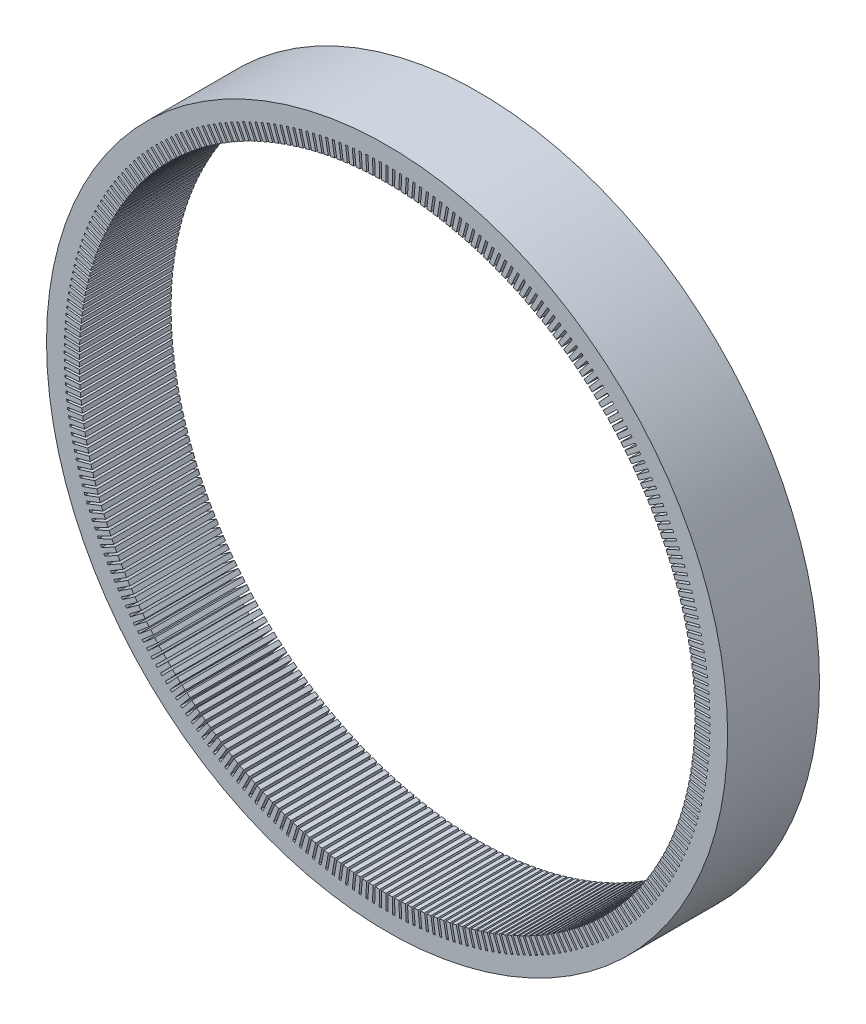
from build123d import *

# Parameters (mm, degrees)
SKETCH1_R           = 3429
BOSS_EXTRUDE1_DEPTH = 925


with BuildPart() as part:
    # Sketch1 → Boss-Extrude1 (new body)
    with BuildSketch(Plane.XY):
        Circle(SKETCH1_R)
        with BuildLine():
            ThreePointArc((-53.898374342, 3098.331229104), (-32.449964619, 3098.63009083), (-11, 3098.780476252))
            Line((-11, 3098.780476252), (-11, 3250.780476252))
            Line((-11, 3250.780476252), (11, 3250.780476252))
            Line((11, 3250.780476252), (11, 3098.780476252))
            ThreePointArc((11, 3098.780476252), (32.449964619, 3098.63009083), (53.898374342, 3098.331229104))
            Line((53.898374342, 3098.331229104), (57.081622164, 3250.297892993))
            Line((57.081622164, 3250.297892993), (79.076797201, 3249.837159755))
            Line((79.076797201, 3249.837159755), (75.893549378, 3097.870495867))
            ThreePointArc((75.893549378, 3097.870495867), (97.335660231, 3097.270929261), (118.773107075, 3096.522951479))
            Line((118.773107075, 3096.522951479), (125.138206442, 3248.389621654))
            Line((125.138206442, 3248.389621654), (147.118908704, 3247.468357272))
            Line((147.118908704, 3247.468357272), (140.753809337, 3095.601687097))
            ThreePointArc((140.753809337, 3095.601687097), (162.178661206, 3094.553202297), (183.595741998, 3093.356436546))
            Line((183.595741998, 3093.356436546), (193.139900967, 3245.056499267))
            Line((193.139900967, 3245.056499267), (215.096488992, 3243.675107837))
            Line((215.096488992, 3243.675107837), (205.552330024, 3091.975045116))
            ThreePointArc((205.552330024, 3091.975045116), (226.950525259, 3090.478102023), (248.337845761, 3088.833073243))
            Line((248.337845761, 3088.833073243), (261.056877948, 3240.299987849))
            Line((261.056877948, 3240.299987849), (282.979720851, 3238.459075296))
            Line((282.979720851, 3238.459075296), (270.260688665, 3086.99216069))
            ThreePointArc((270.260688665, 3086.99216069), (291.622841311, 3085.047415912), (312.971020337, 3082.954845668))
            Line((312.971020337, 3082.954845668), (328.859346754, 3234.122173764))
            Line((328.859346754, 3234.122173764), (350.738828452, 3231.822547572))
            Line((350.738828452, 3231.822547572), (334.850502035, 3080.655219476))
            ThreePointArc((334.850502035, 3080.655219476), (356.167241947, 3078.263526043), (377.46691548, 3075.724332205))
            Line((377.46691548, 3075.724332205), (396.517566982, 3226.525766805))
            Line((396.517566982, 3226.525766805), (418.344090411, 3223.768435666))
            Line((418.344090411, 3223.768435666), (399.293438909, 3072.967001067))
            ThreePointArc((399.293438909, 3072.967001067), (420.555415859, 3070.129408053), (441.797241158, 3067.144704396))
            Line((441.797241158, 3067.144704396), (464.0018615, 3217.514099006))
            Line((464.0018615, 3217.514099006), (485.765852825, 3214.300272378))
            Line((485.765852825, 3214.300272378), (463.561232484, 3063.930877768))
            ThreePointArc((463.561232484, 3063.930877768), (484.759120267, 3060.648629836), (505.933779965, 3057.21972555))
            Line((505.933779965, 3057.21972555), (531.282629466, 3207.091123184))
            Line((531.282629466, 3207.091123184), (552.974542281, 3203.422210757))
            Line((552.974542281, 3203.422210757), (527.625692781, 3053.550813122))
            ThreePointArc((527.625692781, 3053.550813122), (548.750193302, 3049.825349975), (569.848399495, 3045.95374909))
            Line((569.848399495, 3045.95374909), (598.330359312, 3195.2614112))
            Line((598.330359312, 3195.2614112), (619.940678828, 3191.13902228))
            Line((619.940678828, 3191.13902228), (591.458719011, 3041.831360169))
            ThreePointArc((591.458719011, 3041.831360169), (612.500566367, 3037.664315918), (633.513064683, 3033.351716646))
            Line((633.513064683, 3033.351716646), (665.115641687, 3182.030151957))
            Line((665.115641687, 3182.030151957), (686.634888903, 3177.456094759))
            Line((686.634888903, 3177.456094759), (655.032311899, 3028.777659448))
            ThreePointArc((655.032311899, 3028.777659448), (675.98227644, 3024.170861896), (696.899850102, 3019.419155885))
            Line((696.899850102, 3019.419155885), (731.609182359, 3167.403149122))
            Line((731.609182359, 3167.403149122), (753.027918222, 3162.37942998))
            Line((753.027918222, 3162.37942998), (718.318585966, 3014.395436743))
            ThreePointArc((718.318585966, 3014.395436743), (739.167478345, 3009.350906584), (759.980952215, 3004.162178091))
            Line((759.980952215, 3004.162178091), (797.781815064, 3151.386818582))
            Line((797.781815064, 3151.386818582), (819.090644609, 3145.915641064))
            Line((819.090644609, 3145.915641064), (781.28978176, 2998.691000573))
            ThreePointArc((781.28978176, 2998.691000573), (802.028456964, 2993.210950505), (822.728701565, 2987.587475476))
            Line((822.728701565, 2987.587475476), (863.604514298, 3133.988185629))
            Line((863.604514298, 3133.988185629), (884.794090768, 3128.071949576))
            Line((884.794090768, 3128.071949576), (843.918278035, 2981.671239422))
            ThreePointArc((843.918278035, 2981.671239422), (864.537639394, 2975.758073176), (885.115574915, 2969.702318254))
            Line((885.115574915, 2969.702318254), (929.04840805, 3115.214881879))
            Line((929.04840805, 3115.214881879), (950.109436996, 3108.856182346))
            Line((950.109436996, 3108.856182346), (906.17660386, 2963.343618721))
            ThreePointArc((906.17660386, 2963.343618721), (926.667607043, 2956.999930006), (947.11420732, 2950.514551446))
            Line((947.11420732, 2950.514551446), (994.084790465, 3095.075141923))
            Line((994.084790465, 3095.075141923), (1015.008033823, 3088.276768046))
            Line((1015.008033823, 3088.276768046), (968.037450678, 2943.716177569))
            ThreePointArc((968.037450678, 2943.716177569), (988.391107653, 2936.944748938), (1008.697404131, 2930.03259144))
            Line((1008.697404131, 2930.03259144), (1058.685134436, 3073.577799716))
            Line((1058.685134436, 3073.577799716), (1079.461414581, 3066.342733488))
            Line((1079.461414581, 3066.342733488), (1029.473684277, 2922.797525211))
            ThreePointArc((1029.473684277, 2922.797525211), (1049.681067256, 2915.601326835), (1069.838152924, 2908.265422301))
            Line((1069.838152924, 2908.265422301), (1122.821104117, 3050.732284703))
            Line((1122.821104117, 3050.732284703), (1143.441307885, 3043.063699662))
            Line((1143.441307885, 3043.063699662), (1090.458356692, 2900.596837259))
            ThreePointArc((1090.458356692, 2900.596837259), (1110.510602051, 2892.97902563), (1130.509635343, 2885.222591828))
            Line((1130.509635343, 2885.222591828), (1186.464567352, 3026.548617683))
            Line((1186.464567352, 3026.548617683), (1206.919650041, 3018.449877524))
            Line((1206.919650041, 3018.449877524), (1150.964718033, 2877.123851669))
            ThreePointArc((1150.964718033, 2877.123851669), (1170.853030193, 2869.087768209), (1190.685238874, 2860.914207369))
            Line((1190.685238874, 2860.914207369), (1249.587608014, 3001.037406411))
            Line((1249.587608014, 3001.037406411), (1269.868597349, 2992.512063509))
            Line((1269.868597349, 2992.512063509), (1210.966228209, 2852.388864468))
            ThreePointArc((1210.966228209, 2852.388864468), (1230.681883499, 2843.93803407), (1250.338568505, 2835.350931385))
            Line((1250.338568505, 2835.350931385), (1312.162538253, 2974.209840947))
            Line((1312.162538253, 2974.209840947), (1332.260538321, 2965.261634799))
            Line((1332.260538321, 2965.261634799), (1270.436568574, 2826.402725238))
            ThreePointArc((1270.436568574, 2826.402725238), (1289.970919057, 2817.540854715), (1309.443458317, 2808.543976773))
            Line((1309.443458317, 2808.543976773), (1374.161910635, 2946.077688748))
            Line((1374.161910635, 2946.077688748), (1394.068105789, 2936.710544334))
            Line((1394.068105789, 2936.710544334), (1329.349653471, 2799.176832359))
            ThreePointArc((1329.349653471, 2799.176832359), (1348.694130735, 2789.907808821), (1367.97398295, 2780.50510195))
            Line((1367.97398295, 2780.50510195), (1435.558530186, 2916.653289507))
            Line((1435.558530186, 2916.653289507), (1455.264188912, 2906.871315564))
            Line((1455.264188912, 2906.871315564), (1387.679641676, 2770.723128008))
            ThreePointArc((1387.679641676, 2770.723128008), (1406.825760593, 2761.051017155), (1425.904468983, 2751.246605693))
            Line((1425.904468983, 2751.246605693), (1496.325466321, 2885.949549736))
            Line((1496.325466321, 2885.949549736), (1515.821945064, 2875.757036963))
            Line((1515.821945064, 2875.757036963), (1445.400947726, 2741.05409292))
            ThreePointArc((1445.400947726, 2741.05409292), (1464.340310176, 2730.983137259), (1483.209506189, 2720.781321744))
            Line((1483.209506189, 2720.781321744), (1556.436064652, 2853.979937111))
            Line((1556.436064652, 2853.979937111), (1575.714811613, 2843.381356281))
            Line((1575.714811613, 2843.381356281), (1502.48825315, 2710.182740914))
            ThreePointArc((1502.48825315, 2710.182740914), (1521.212551703, 2699.717357899), (1539.863958684, 2689.122613185))
            Line((1539.863958684, 2689.122613185), (1615.863958684, 2820.758474561))
            Line((1615.863958684, 2820.758474561), (1634.916517568, 2809.758474561))
            Line((1634.916517568, 2809.758474561), (1558.916517568, 2678.122613185))
            ThreePointArc((1558.916517568, 2678.122613185), (1577.417539127, 2667.26739328), (1595.842975955, 2656.284366572))
            Line((1595.842975955, 2656.284366572), (1674.58308138, 2786.299734117))
            Line((1674.58308138, 2786.299734117), (1693.401095103, 2774.90313991))
            Line((1693.401095103, 2774.90313991), (1614.660989678, 2644.887772366))
            ThreePointArc((1614.660989678, 2644.887772366), (1632.930619085, 2633.647477028), (1651.122003753, 2622.280985845))
            Line((1651.122003753, 2622.280985845), (1732.56767659, 2750.618830521))
            Line((1732.56767659, 2750.618830521), (1751.142890951, 2738.830641031))
            Line((1751.142890951, 2738.830641031), (1669.697218114, 2610.492796355))
            ThreePointArc((1669.697218114, 2610.492796355), (1687.727441705, 2598.872355949), (1705.67679487, 2587.12738601))
            Line((1705.67679487, 2587.12738601), (1789.792310355, 2713.731414598))
            Line((1789.792310355, 2713.731414598), (1808.116577651, 2701.556800514))
            Line((1808.116577651, 2701.556800514), (1724.001062166, 2574.952771926))
            ThreePointArc((1724.001062166, 2574.952771926), (1741.783971288, 2562.957283562), (1759.483419772, 2550.838986598))
            Line((1759.483419772, 2550.838986598), (1846.23188206, 2675.653666386))
            Line((1846.23188206, 2675.653666386), (1864.297164661, 2663.097967897))
            Line((1864.297164661, 2663.097967897), (1777.548702373, 2538.283288109))
            ThreePointArc((1777.548702373, 2538.283288109), (1795.076496855, 2525.918013404), (1812.518277095, 2513.4317049))
            Line((1812.518277095, 2513.4317049), (1901.861635443, 2636.402288045))
            Line((1901.861635443, 2636.402288045), (1919.660009319, 2623.471012495))
            Line((1919.660009319, 2623.471012495), (1830.316650971, 2500.50042935))
            ThreePointArc((1830.316650971, 2500.50042935), (1847.581642543, 2487.770792122), (1864.758103996, 2474.921948987))
            Line((1864.758103996, 2474.921948987), (1956.657169456, 2595.994496527))
            Line((1956.657169456, 2595.994496527), (1974.180827652, 2582.693316))
            Line((1974.180827652, 2582.693316), (1882.281762193, 2461.62076846))
            ThreePointArc((1882.281762193, 2461.62076846), (1899.27637786, 2448.53235235), (1916.179986363, 2435.326610511))
            Line((1916.179986363, 2435.326610511), (2010.594448965, 2554.448016024))
            Line((2010.594448965, 2554.448016024), (2027.835705027, 2540.782764858))
            Line((2027.835705027, 2540.782764858), (1933.421242424, 2421.661359345))
            ThreePointArc((1933.421242424, 2421.661359345), (1950.138027785, 2408.219905363), (1966.761368857, 2394.663057294))
            Line((1966.761368857, 2394.663057294), (2063.649815299, 2511.781070196))
            Line((2063.649815299, 2511.781070196), (2080.60110664, 2497.757742422))
            Line((2080.60110664, 2497.757742422), (1983.712660198, 2380.63972952))
            ThreePointArc((1983.712660198, 2380.63972952), (2000.144282719, 2366.851133533), (2016.480064813, 2352.949125717))
            Line((2016.480064813, 2352.949125717), (2115.79999662, 2468.012374176))
            Line((2115.79999662, 2468.012374176), (2132.453887844, 2453.637120888))
            Line((2132.453887844, 2453.637120888), (2033.133956037, 2338.573872429))
            ThreePointArc((2033.133956037, 2338.573872429), (2049.273208265, 2324.444182571), (2065.314265967, 2310.203112887))
            Line((2065.314265967, 2310.203112887), (2167.022118134, 2423.161126359))
            Line((2167.022118134, 2423.161126359), (2183.371304294, 2408.44025302))
            Line((2183.371304294, 2408.44025302), (2081.663452128, 2295.482239547))
            ThreePointArc((2081.663452128, 2295.482239547), (2097.503254853, 2281.017653567), (2113.242552025, 2266.443768619))
            Line((2113.242552025, 2266.443768619), (2217.293712126, 2377.246999987))
            Line((2217.293712126, 2377.246999987), (2233.331021929, 2362.186963656))
            Line((2233.331021929, 2362.186963656), (2129.279861828, 2251.383732288))
            ThreePointArc((2129.279861828, 2251.383732288), (2144.81326719, 2236.590594831), (2160.243900056, 2221.690287207))
            Line((2160.243900056, 2221.690287207), (2266.592727814, 2330.290134511))
            Line((2266.592727814, 2330.290134511), (2282.311126766, 2314.89754102))
            Line((2282.311126766, 2314.89754102), (2175.962299008, 2206.297693716))
            ThreePointArc((2175.962299008, 2206.297693716), (2191.182493541, 2191.182493541), (2206.297693716, 2175.962299008))
            Line((2206.297693716, 2175.962299008), (2314.89754102, 2282.311126766))
            Line((2314.89754102, 2282.311126766), (2330.290134511, 2266.592727814))
            Line((2330.290134511, 2266.592727814), (2221.690287207, 2160.243900056))
            ThreePointArc((2221.690287207, 2160.243900056), (2236.590594831, 2144.81326719), (2251.383732288, 2129.279861828))
            Line((2251.383732288, 2129.279861828), (2362.186963656, 2233.331021929))
            Line((2362.186963656, 2233.331021929), (2377.246999987, 2217.293712126))
            Line((2377.246999987, 2217.293712126), (2266.443768619, 2113.242552025))
            ThreePointArc((2266.443768619, 2113.242552025), (2281.017653567, 2097.503254853), (2295.482239547, 2081.663452128))
            Line((2295.482239547, 2081.663452128), (2408.44025302, 2183.371304294))
            Line((2408.44025302, 2183.371304294), (2423.161126359, 2167.022118134))
            Line((2423.161126359, 2167.022118134), (2310.203112887, 2065.314265967))
            ThreePointArc((2310.203112887, 2065.314265967), (2324.444182571, 2049.273208265), (2338.573872429, 2033.133956037))
            Line((2338.573872429, 2033.133956037), (2453.637120888, 2132.453887844))
            Line((2453.637120888, 2132.453887844), (2468.012374176, 2115.79999662))
            Line((2468.012374176, 2115.79999662), (2352.949125717, 2016.480064813))
            ThreePointArc((2352.949125717, 2016.480064813), (2366.851133533, 2000.144282719), (2380.63972952, 1983.712660198))
            Line((2380.63972952, 1983.712660198), (2497.757742422, 2080.60110664))
            Line((2497.757742422, 2080.60110664), (2511.781070196, 2063.649815299))
            Line((2511.781070196, 2063.649815299), (2394.663057294, 1966.761368857))
            ThreePointArc((2394.663057294, 1966.761368857), (2408.219905363, 1950.138027785), (2421.661359345, 1933.421242424))
            Line((2421.661359345, 1933.421242424), (2540.782764858, 2027.835705027))
            Line((2540.782764858, 2027.835705027), (2554.448016024, 2010.594448965))
            Line((2554.448016024, 2010.594448965), (2435.326610511, 1916.179986363))
            ThreePointArc((2435.326610511, 1916.179986363), (2448.53235235, 1899.27637786), (2461.62076846, 1882.281762193))
            Line((2461.62076846, 1882.281762193), (2582.693316, 1974.180827652))
            Line((2582.693316, 1974.180827652), (2595.994496527, 1956.657169456))
            Line((2595.994496527, 1956.657169456), (2474.921948987, 1864.758103996))
            ThreePointArc((2474.921948987, 1864.758103996), (2487.770792122, 1847.581642543), (2500.50042935, 1830.316650971))
            Line((2500.50042935, 1830.316650971), (2623.471012495, 1919.660009319))
            Line((2623.471012495, 1919.660009319), (2636.402288045, 1901.861635443))
            Line((2636.402288045, 1901.861635443), (2513.4317049, 1812.518277095))
            ThreePointArc((2513.4317049, 1812.518277095), (2525.918013404, 1795.076496855), (2538.283288109, 1777.548702373))
            Line((2538.283288109, 1777.548702373), (2663.097967897, 1864.297164661))
            Line((2663.097967897, 1864.297164661), (2675.653666386, 1846.23188206))
            Line((2675.653666386, 1846.23188206), (2550.838986598, 1759.483419772))
            ThreePointArc((2550.838986598, 1759.483419772), (2562.957283562, 1741.783971288), (2574.952771926, 1724.001062166))
            Line((2574.952771926, 1724.001062166), (2701.556800514, 1808.116577651))
            Line((2701.556800514, 1808.116577651), (2713.731414598, 1789.792310355))
            Line((2713.731414598, 1789.792310355), (2587.12738601, 1705.67679487))
            ThreePointArc((2587.12738601, 1705.67679487), (2598.872355949, 1687.727441705), (2610.492796355, 1669.697218114))
            Line((2610.492796355, 1669.697218114), (2738.830641031, 1751.142890951))
            Line((2738.830641031, 1751.142890951), (2750.618830521, 1732.56767659))
            Line((2750.618830521, 1732.56767659), (2622.280985845, 1651.122003753))
            ThreePointArc((2622.280985845, 1651.122003753), (2633.647477028, 1632.930619085), (2644.887772366, 1614.660989678))
            Line((2644.887772366, 1614.660989678), (2774.90313991, 1693.401095103))
            Line((2774.90313991, 1693.401095103), (2786.299734117, 1674.58308138))
            Line((2786.299734117, 1674.58308138), (2656.284366572, 1595.842975955))
            ThreePointArc((2656.284366572, 1595.842975955), (2667.26739328, 1577.417539127), (2678.122613185, 1558.916517568))
            Line((2678.122613185, 1558.916517568), (2809.758474561, 1634.916517568))
            Line((2809.758474561, 1634.916517568), (2820.758474561, 1615.863958684))
            Line((2820.758474561, 1615.863958684), (2689.122613185, 1539.863958684))
            ThreePointArc((2689.122613185, 1539.863958684), (2699.717357899, 1521.212551703), (2710.182740914, 1502.48825315))
            Line((2710.182740914, 1502.48825315), (2843.381356281, 1575.714811613))
            Line((2843.381356281, 1575.714811613), (2853.979937111, 1556.436064652))
            Line((2853.979937111, 1556.436064652), (2720.781321744, 1483.209506189))
            ThreePointArc((2720.781321744, 1483.209506189), (2730.983137259, 1464.340310176), (2741.05409292, 1445.400947726))
            Line((2741.05409292, 1445.400947726), (2875.757036963, 1515.821945064))
            Line((2875.757036963, 1515.821945064), (2885.949549736, 1496.325466321))
            Line((2885.949549736, 1496.325466321), (2751.246605693, 1425.904468983))
            ThreePointArc((2751.246605693, 1425.904468983), (2761.051017155, 1406.825760593), (2770.723128008, 1387.679641676))
            Line((2770.723128008, 1387.679641676), (2906.871315564, 1455.264188912))
            Line((2906.871315564, 1455.264188912), (2916.653289507, 1435.558530186))
            Line((2916.653289507, 1435.558530186), (2780.50510195, 1367.97398295))
            ThreePointArc((2780.50510195, 1367.97398295), (2789.907808821, 1348.694130735), (2799.176832359, 1329.349653471))
            Line((2799.176832359, 1329.349653471), (2936.710544334, 1394.068105789))
            Line((2936.710544334, 1394.068105789), (2946.077688748, 1374.161910635))
            Line((2946.077688748, 1374.161910635), (2808.543976773, 1309.443458317))
            ThreePointArc((2808.543976773, 1309.443458317), (2817.540854715, 1289.970919057), (2826.402725238, 1270.436568574))
            Line((2826.402725238, 1270.436568574), (2965.261634799, 1332.260538321))
            Line((2965.261634799, 1332.260538321), (2974.209840947, 1312.162538253))
            Line((2974.209840947, 1312.162538253), (2835.350931385, 1250.338568505))
            ThreePointArc((2835.350931385, 1250.338568505), (2843.93803407, 1230.681883499), (2852.388864468, 1210.966228209))
            Line((2852.388864468, 1210.966228209), (2992.512063509, 1269.868597349))
            Line((2992.512063509, 1269.868597349), (3001.037406411, 1249.587608014))
            Line((3001.037406411, 1249.587608014), (2860.914207369, 1190.685238874))
            ThreePointArc((2860.914207369, 1190.685238874), (2869.087768209, 1170.853030193), (2877.123851669, 1150.964718033))
            Line((2877.123851669, 1150.964718033), (3018.449877524, 1206.919650041))
            Line((3018.449877524, 1206.919650041), (3026.548617683, 1186.464567352))
            Line((3026.548617683, 1186.464567352), (2885.222591828, 1130.509635343))
            ThreePointArc((2885.222591828, 1130.509635343), (2892.97902563, 1110.510602051), (2900.596837259, 1090.458356692))
            Line((2900.596837259, 1090.458356692), (3043.063699662, 1143.441307885))
            Line((3043.063699662, 1143.441307885), (3050.732284703, 1122.821104117))
            Line((3050.732284703, 1122.821104117), (2908.265422301, 1069.838152924))
            ThreePointArc((2908.265422301, 1069.838152924), (2915.601326835, 1049.681067256), (2922.797525211, 1029.473684277))
            Line((2922.797525211, 1029.473684277), (3066.342733488, 1079.461414581))
            Line((3066.342733488, 1079.461414581), (3073.577799716, 1058.685134436))
            Line((3073.577799716, 1058.685134436), (2930.03259144, 1008.697404131))
            ThreePointArc((2930.03259144, 1008.697404131), (2936.944748938, 988.391107653), (2943.716177569, 968.037450678))
            Line((2943.716177569, 968.037450678), (3088.276768046, 1015.008033823))
            Line((3088.276768046, 1015.008033823), (3095.075141923, 994.084790465))
            Line((3095.075141923, 994.084790465), (2950.514551446, 947.11420732))
            ThreePointArc((2950.514551446, 947.11420732), (2956.999930006, 926.667607043), (2963.343618721, 906.17660386))
            Line((2963.343618721, 906.17660386), (3108.856182346, 950.109436996))
            Line((3108.856182346, 950.109436996), (3115.214881879, 929.04840805))
            Line((3115.214881879, 929.04840805), (2969.702318254, 885.115574915))
            ThreePointArc((2969.702318254, 885.115574915), (2975.758073176, 864.537639394), (2981.671239422, 843.918278035))
            Line((2981.671239422, 843.918278035), (3128.071949576, 884.794090768))
            Line((3128.071949576, 884.794090768), (3133.988185629, 863.604514298))
            Line((3133.988185629, 863.604514298), (2987.587475476, 822.728701565))
            ThreePointArc((2987.587475476, 822.728701565), (2993.210950505, 802.028456964), (2998.691000573, 781.28978176))
            Line((2998.691000573, 781.28978176), (3145.915641064, 819.090644609))
            Line((3145.915641064, 819.090644609), (3151.386818582, 797.781815064))
            Line((3151.386818582, 797.781815064), (3004.162178091, 759.980952215))
            ThreePointArc((3004.162178091, 759.980952215), (3009.350906584, 739.167478345), (3014.395436743, 718.318585966))
            Line((3014.395436743, 718.318585966), (3162.37942998, 753.027918222))
            Line((3162.37942998, 753.027918222), (3167.403149122, 731.609182359))
            Line((3167.403149122, 731.609182359), (3019.419155885, 696.899850102))
            ThreePointArc((3019.419155885, 696.899850102), (3024.170861896, 675.98227644), (3028.777659448, 655.032311899))
            Line((3028.777659448, 655.032311899), (3177.456094759, 686.634888903))
            Line((3177.456094759, 686.634888903), (3182.030151957, 665.115641687))
            Line((3182.030151957, 665.115641687), (3033.351716646, 633.513064683))
            ThreePointArc((3033.351716646, 633.513064683), (3037.664315918, 612.500566367), (3041.831360169, 591.458719011))
            Line((3041.831360169, 591.458719011), (3191.13902228, 619.940678828))
            Line((3191.13902228, 619.940678828), (3195.2614112, 598.330359312))
            Line((3195.2614112, 598.330359312), (3045.95374909, 569.848399495))
            ThreePointArc((3045.95374909, 569.848399495), (3049.825349975, 548.750193302), (3053.550813122, 527.625692781))
            Line((3053.550813122, 527.625692781), (3203.422210757, 552.974542281))
            Line((3203.422210757, 552.974542281), (3207.091123184, 531.282629466))
            Line((3207.091123184, 531.282629466), (3057.21972555, 505.933779965))
            ThreePointArc((3057.21972555, 505.933779965), (3060.648629836, 484.759120267), (3063.930877768, 463.561232484))
            Line((3063.930877768, 463.561232484), (3214.300272378, 485.765852825))
            Line((3214.300272378, 485.765852825), (3217.514099006, 464.0018615))
            Line((3217.514099006, 464.0018615), (3067.144704396, 441.797241158))
            ThreePointArc((3067.144704396, 441.797241158), (3070.129408053, 420.555415859), (3072.967001067, 399.293438909))
            Line((3072.967001067, 399.293438909), (3223.768435666, 418.344090411))
            Line((3223.768435666, 418.344090411), (3226.525766805, 396.517566982))
            Line((3226.525766805, 396.517566982), (3075.724332205, 377.46691548))
            ThreePointArc((3075.724332205, 377.46691548), (3078.263526043, 356.167241947), (3080.655219476, 334.850502035))
            Line((3080.655219476, 334.850502035), (3231.822547572, 350.738828452))
            Line((3231.822547572, 350.738828452), (3234.122173764, 328.859346754))
            Line((3234.122173764, 328.859346754), (3082.954845668, 312.971020337))
            ThreePointArc((3082.954845668, 312.971020337), (3085.047415912, 291.622841311), (3086.99216069, 270.260688665))
            Line((3086.99216069, 270.260688665), (3238.459075296, 282.979720851))
            Line((3238.459075296, 282.979720851), (3240.299987849, 261.056877948))
            Line((3240.299987849, 261.056877948), (3088.833073243, 248.337845761))
            ThreePointArc((3088.833073243, 248.337845761), (3090.478102023, 226.950525259), (3091.975045116, 205.552330024))
            Line((3091.975045116, 205.552330024), (3243.675107837, 215.096488992))
            Line((3243.675107837, 215.096488992), (3245.056499267, 193.139900967))
            Line((3245.056499267, 193.139900967), (3093.356436546, 183.595741998))
            ThreePointArc((3093.356436546, 183.595741998), (3094.553202297, 162.178661206), (3095.601687097, 140.753809337))
            Line((3095.601687097, 140.753809337), (3247.468357272, 147.118908704))
            Line((3247.468357272, 147.118908704), (3248.389621654, 125.138206442))
            Line((3248.389621654, 125.138206442), (3096.522951479, 118.773107075))
            ThreePointArc((3096.522951479, 118.773107075), (3097.270929261, 97.335660231), (3097.870495867, 75.893549378))
            Line((3097.870495867, 75.893549378), (3249.837159755, 79.076797201))
            Line((3249.837159755, 79.076797201), (3250.297892993, 57.081622164))
            Line((3250.297892993, 57.081622164), (3098.331229104, 53.898374342))
            ThreePointArc((3098.331229104, 53.898374342), (3098.63009083, 32.449964619), (3098.780476252, 11))
            Line((3098.780476252, 11), (3250.780476252, 11))
            Line((3250.780476252, 11), (3250.780476252, -11))
            Line((3250.780476252, -11), (3098.780476252, -11))
            ThreePointArc((3098.780476252, -11), (3098.63009083, -32.449964619), (3098.331229104, -53.898374342))
            Line((3098.331229104, -53.898374342), (3250.297892993, -57.081622164))
            Line((3250.297892993, -57.081622164), (3249.837159755, -79.076797201))
            Line((3249.837159755, -79.076797201), (3097.870495867, -75.893549378))
            ThreePointArc((3097.870495867, -75.893549378), (3097.270929261, -97.335660231), (3096.522951479, -118.773107075))
            Line((3096.522951479, -118.773107075), (3248.389621654, -125.138206442))
            Line((3248.389621654, -125.138206442), (3247.468357272, -147.118908704))
            Line((3247.468357272, -147.118908704), (3095.601687097, -140.753809337))
            ThreePointArc((3095.601687097, -140.753809337), (3094.553202297, -162.178661206), (3093.356436546, -183.595741998))
            Line((3093.356436546, -183.595741998), (3245.056499267, -193.139900967))
            Line((3245.056499267, -193.139900967), (3243.675107837, -215.096488992))
            Line((3243.675107837, -215.096488992), (3091.975045116, -205.552330024))
            ThreePointArc((3091.975045116, -205.552330024), (3090.478102023, -226.950525259), (3088.833073243, -248.337845761))
            Line((3088.833073243, -248.337845761), (3240.299987849, -261.056877948))
            Line((3240.299987849, -261.056877948), (3238.459075296, -282.979720851))
            Line((3238.459075296, -282.979720851), (3086.99216069, -270.260688665))
            ThreePointArc((3086.99216069, -270.260688665), (3085.047415912, -291.622841311), (3082.954845668, -312.971020337))
            Line((3082.954845668, -312.971020337), (3234.122173764, -328.859346754))
            Line((3234.122173764, -328.859346754), (3231.822547572, -350.738828452))
            Line((3231.822547572, -350.738828452), (3080.655219476, -334.850502035))
            ThreePointArc((3080.655219476, -334.850502035), (3078.263526043, -356.167241947), (3075.724332205, -377.46691548))
            Line((3075.724332205, -377.46691548), (3226.525766805, -396.517566982))
            Line((3226.525766805, -396.517566982), (3223.768435666, -418.344090411))
            Line((3223.768435666, -418.344090411), (3072.967001067, -399.293438909))
            ThreePointArc((3072.967001067, -399.293438909), (3070.129408053, -420.555415859), (3067.144704396, -441.797241158))
            Line((3067.144704396, -441.797241158), (3217.514099006, -464.0018615))
            Line((3217.514099006, -464.0018615), (3214.300272378, -485.765852825))
            Line((3214.300272378, -485.765852825), (3063.930877768, -463.561232484))
            ThreePointArc((3063.930877768, -463.561232484), (3060.648629836, -484.759120267), (3057.21972555, -505.933779965))
            Line((3057.21972555, -505.933779965), (3207.091123184, -531.282629466))
            Line((3207.091123184, -531.282629466), (3203.422210757, -552.974542281))
            Line((3203.422210757, -552.974542281), (3053.550813122, -527.625692781))
            ThreePointArc((3053.550813122, -527.625692781), (3049.825349975, -548.750193302), (3045.95374909, -569.848399495))
            Line((3045.95374909, -569.848399495), (3195.2614112, -598.330359312))
            Line((3195.2614112, -598.330359312), (3191.13902228, -619.940678828))
            Line((3191.13902228, -619.940678828), (3041.831360169, -591.458719011))
            ThreePointArc((3041.831360169, -591.458719011), (3037.664315918, -612.500566367), (3033.351716646, -633.513064683))
            Line((3033.351716646, -633.513064683), (3182.030151957, -665.115641687))
            Line((3182.030151957, -665.115641687), (3177.456094759, -686.634888903))
            Line((3177.456094759, -686.634888903), (3028.777659448, -655.032311899))
            ThreePointArc((3028.777659448, -655.032311899), (3024.170861896, -675.98227644), (3019.419155885, -696.899850102))
            Line((3019.419155885, -696.899850102), (3167.403149122, -731.609182359))
            Line((3167.403149122, -731.609182359), (3162.37942998, -753.027918222))
            Line((3162.37942998, -753.027918222), (3014.395436743, -718.318585966))
            ThreePointArc((3014.395436743, -718.318585966), (3009.350906584, -739.167478345), (3004.162178091, -759.980952215))
            Line((3004.162178091, -759.980952215), (3151.386818582, -797.781815064))
            Line((3151.386818582, -797.781815064), (3145.915641064, -819.090644609))
            Line((3145.915641064, -819.090644609), (2998.691000573, -781.28978176))
            ThreePointArc((2998.691000573, -781.28978176), (2993.210950505, -802.028456964), (2987.587475476, -822.728701565))
            Line((2987.587475476, -822.728701565), (3133.988185629, -863.604514298))
            Line((3133.988185629, -863.604514298), (3128.071949576, -884.794090768))
            Line((3128.071949576, -884.794090768), (2981.671239422, -843.918278035))
            ThreePointArc((2981.671239422, -843.918278035), (2975.758073176, -864.537639394), (2969.702318254, -885.115574915))
            Line((2969.702318254, -885.115574915), (3115.214881879, -929.04840805))
            Line((3115.214881879, -929.04840805), (3108.856182346, -950.109436996))
            Line((3108.856182346, -950.109436996), (2963.343618721, -906.17660386))
            ThreePointArc((2963.343618721, -906.17660386), (2956.999930006, -926.667607043), (2950.514551446, -947.11420732))
            Line((2950.514551446, -947.11420732), (3095.075141923, -994.084790465))
            Line((3095.075141923, -994.084790465), (3088.276768046, -1015.008033823))
            Line((3088.276768046, -1015.008033823), (2943.716177569, -968.037450678))
            ThreePointArc((2943.716177569, -968.037450678), (2936.944748938, -988.391107653), (2930.03259144, -1008.697404131))
            Line((2930.03259144, -1008.697404131), (3073.577799716, -1058.685134436))
            Line((3073.577799716, -1058.685134436), (3066.342733488, -1079.461414581))
            Line((3066.342733488, -1079.461414581), (2922.797525211, -1029.473684277))
            ThreePointArc((2922.797525211, -1029.473684277), (2915.601326835, -1049.681067256), (2908.265422301, -1069.838152924))
            Line((2908.265422301, -1069.838152924), (3050.732284703, -1122.821104117))
            Line((3050.732284703, -1122.821104117), (3043.063699662, -1143.441307885))
            Line((3043.063699662, -1143.441307885), (2900.596837259, -1090.458356692))
            ThreePointArc((2900.596837259, -1090.458356692), (2892.97902563, -1110.510602051), (2885.222591828, -1130.509635343))
            Line((2885.222591828, -1130.509635343), (3026.548617683, -1186.464567352))
            Line((3026.548617683, -1186.464567352), (3018.449877524, -1206.919650041))
            Line((3018.449877524, -1206.919650041), (2877.123851669, -1150.964718033))
            ThreePointArc((2877.123851669, -1150.964718033), (2869.087768209, -1170.853030193), (2860.914207369, -1190.685238874))
            Line((2860.914207369, -1190.685238874), (3001.037406411, -1249.587608014))
            Line((3001.037406411, -1249.587608014), (2992.512063509, -1269.868597349))
            Line((2992.512063509, -1269.868597349), (2852.388864468, -1210.966228209))
            ThreePointArc((2852.388864468, -1210.966228209), (2843.93803407, -1230.681883499), (2835.350931385, -1250.338568505))
            Line((2835.350931385, -1250.338568505), (2974.209840947, -1312.162538253))
            Line((2974.209840947, -1312.162538253), (2965.261634799, -1332.260538321))
            Line((2965.261634799, -1332.260538321), (2826.402725238, -1270.436568574))
            ThreePointArc((2826.402725238, -1270.436568574), (2817.540854715, -1289.970919057), (2808.543976773, -1309.443458317))
            Line((2808.543976773, -1309.443458317), (2946.077688748, -1374.161910635))
            Line((2946.077688748, -1374.161910635), (2936.710544334, -1394.068105789))
            Line((2936.710544334, -1394.068105789), (2799.176832359, -1329.349653471))
            ThreePointArc((2799.176832359, -1329.349653471), (2789.907808821, -1348.694130735), (2780.50510195, -1367.97398295))
            Line((2780.50510195, -1367.97398295), (2916.653289507, -1435.558530186))
            Line((2916.653289507, -1435.558530186), (2906.871315564, -1455.264188912))
            Line((2906.871315564, -1455.264188912), (2770.723128008, -1387.679641676))
            ThreePointArc((2770.723128008, -1387.679641676), (2761.051017155, -1406.825760593), (2751.246605693, -1425.904468983))
            Line((2751.246605693, -1425.904468983), (2885.949549736, -1496.325466321))
            Line((2885.949549736, -1496.325466321), (2875.757036963, -1515.821945064))
            Line((2875.757036963, -1515.821945064), (2741.05409292, -1445.400947726))
            ThreePointArc((2741.05409292, -1445.400947726), (2730.983137259, -1464.340310176), (2720.781321744, -1483.209506189))
            Line((2720.781321744, -1483.209506189), (2853.979937111, -1556.436064652))
            Line((2853.979937111, -1556.436064652), (2843.381356281, -1575.714811613))
            Line((2843.381356281, -1575.714811613), (2710.182740914, -1502.48825315))
            ThreePointArc((2710.182740914, -1502.48825315), (2699.717357899, -1521.212551703), (2689.122613185, -1539.863958684))
            Line((2689.122613185, -1539.863958684), (2820.758474561, -1615.863958684))
            Line((2820.758474561, -1615.863958684), (2809.758474561, -1634.916517568))
            Line((2809.758474561, -1634.916517568), (2678.122613185, -1558.916517568))
            ThreePointArc((2678.122613185, -1558.916517568), (2667.26739328, -1577.417539127), (2656.284366572, -1595.842975955))
            Line((2656.284366572, -1595.842975955), (2786.299734117, -1674.58308138))
            Line((2786.299734117, -1674.58308138), (2774.90313991, -1693.401095103))
            Line((2774.90313991, -1693.401095103), (2644.887772366, -1614.660989678))
            ThreePointArc((2644.887772366, -1614.660989678), (2633.647477028, -1632.930619085), (2622.280985845, -1651.122003753))
            Line((2622.280985845, -1651.122003753), (2750.618830521, -1732.56767659))
            Line((2750.618830521, -1732.56767659), (2738.830641031, -1751.142890951))
            Line((2738.830641031, -1751.142890951), (2610.492796355, -1669.697218114))
            ThreePointArc((2610.492796355, -1669.697218114), (2598.872355949, -1687.727441705), (2587.12738601, -1705.67679487))
            Line((2587.12738601, -1705.67679487), (2713.731414598, -1789.792310355))
            Line((2713.731414598, -1789.792310355), (2701.556800514, -1808.116577651))
            Line((2701.556800514, -1808.116577651), (2574.952771926, -1724.001062166))
            ThreePointArc((2574.952771926, -1724.001062166), (2562.957283562, -1741.783971288), (2550.838986598, -1759.483419772))
            Line((2550.838986598, -1759.483419772), (2675.653666386, -1846.23188206))
            Line((2675.653666386, -1846.23188206), (2663.097967897, -1864.297164661))
            Line((2663.097967897, -1864.297164661), (2538.283288109, -1777.548702373))
            ThreePointArc((2538.283288109, -1777.548702373), (2525.918013404, -1795.076496855), (2513.4317049, -1812.518277095))
            Line((2513.4317049, -1812.518277095), (2636.402288045, -1901.861635443))
            Line((2636.402288045, -1901.861635443), (2623.471012495, -1919.660009319))
            Line((2623.471012495, -1919.660009319), (2500.50042935, -1830.316650971))
            ThreePointArc((2500.50042935, -1830.316650971), (2487.770792122, -1847.581642543), (2474.921948987, -1864.758103996))
            Line((2474.921948987, -1864.758103996), (2595.994496527, -1956.657169456))
            Line((2595.994496527, -1956.657169456), (2582.693316, -1974.180827652))
            Line((2582.693316, -1974.180827652), (2461.62076846, -1882.281762193))
            ThreePointArc((2461.62076846, -1882.281762193), (2448.53235235, -1899.27637786), (2435.326610511, -1916.179986363))
            Line((2435.326610511, -1916.179986363), (2554.448016024, -2010.594448965))
            Line((2554.448016024, -2010.594448965), (2540.782764858, -2027.835705027))
            Line((2540.782764858, -2027.835705027), (2421.661359345, -1933.421242424))
            ThreePointArc((2421.661359345, -1933.421242424), (2408.219905363, -1950.138027785), (2394.663057294, -1966.761368857))
            Line((2394.663057294, -1966.761368857), (2511.781070196, -2063.649815299))
            Line((2511.781070196, -2063.649815299), (2497.757742422, -2080.60110664))
            Line((2497.757742422, -2080.60110664), (2380.63972952, -1983.712660198))
            ThreePointArc((2380.63972952, -1983.712660198), (2366.851133533, -2000.144282719), (2352.949125717, -2016.480064813))
            Line((2352.949125717, -2016.480064813), (2468.012374176, -2115.79999662))
            Line((2468.012374176, -2115.79999662), (2453.637120888, -2132.453887844))
            Line((2453.637120888, -2132.453887844), (2338.573872429, -2033.133956037))
            ThreePointArc((2338.573872429, -2033.133956037), (2324.444182571, -2049.273208265), (2310.203112887, -2065.314265967))
            Line((2310.203112887, -2065.314265967), (2423.161126359, -2167.022118134))
            Line((2423.161126359, -2167.022118134), (2408.44025302, -2183.371304294))
            Line((2408.44025302, -2183.371304294), (2295.482239547, -2081.663452128))
            ThreePointArc((2295.482239547, -2081.663452128), (2281.017653567, -2097.503254853), (2266.443768619, -2113.242552025))
            Line((2266.443768619, -2113.242552025), (2377.246999987, -2217.293712126))
            Line((2377.246999987, -2217.293712126), (2362.186963656, -2233.331021929))
            Line((2362.186963656, -2233.331021929), (2251.383732288, -2129.279861828))
            ThreePointArc((2251.383732288, -2129.279861828), (2236.590594831, -2144.81326719), (2221.690287207, -2160.243900056))
            Line((2221.690287207, -2160.243900056), (2330.290134511, -2266.592727814))
            Line((2330.290134511, -2266.592727814), (2314.89754102, -2282.311126766))
            Line((2314.89754102, -2282.311126766), (2206.297693716, -2175.962299008))
            ThreePointArc((2206.297693716, -2175.962299008), (2191.182493541, -2191.182493541), (2175.962299008, -2206.297693716))
            Line((2175.962299008, -2206.297693716), (2282.311126766, -2314.89754102))
            Line((2282.311126766, -2314.89754102), (2266.592727814, -2330.290134511))
            Line((2266.592727814, -2330.290134511), (2160.243900056, -2221.690287207))
            ThreePointArc((2160.243900056, -2221.690287207), (2144.81326719, -2236.590594831), (2129.279861828, -2251.383732288))
            Line((2129.279861828, -2251.383732288), (2233.331021929, -2362.186963656))
            Line((2233.331021929, -2362.186963656), (2217.293712126, -2377.246999987))
            Line((2217.293712126, -2377.246999987), (2113.242552025, -2266.443768619))
            ThreePointArc((2113.242552025, -2266.443768619), (2097.503254853, -2281.017653567), (2081.663452128, -2295.482239547))
            Line((2081.663452128, -2295.482239547), (2183.371304294, -2408.44025302))
            Line((2183.371304294, -2408.44025302), (2167.022118134, -2423.161126359))
            Line((2167.022118134, -2423.161126359), (2065.314265967, -2310.203112887))
            ThreePointArc((2065.314265967, -2310.203112887), (2049.273208265, -2324.444182571), (2033.133956037, -2338.573872429))
            Line((2033.133956037, -2338.573872429), (2132.453887844, -2453.637120888))
            Line((2132.453887844, -2453.637120888), (2115.79999662, -2468.012374176))
            Line((2115.79999662, -2468.012374176), (2016.480064813, -2352.949125717))
            ThreePointArc((2016.480064813, -2352.949125717), (2000.144282719, -2366.851133533), (1983.712660198, -2380.63972952))
            Line((1983.712660198, -2380.63972952), (2080.60110664, -2497.757742422))
            Line((2080.60110664, -2497.757742422), (2063.649815299, -2511.781070196))
            Line((2063.649815299, -2511.781070196), (1966.761368857, -2394.663057294))
            ThreePointArc((1966.761368857, -2394.663057294), (1950.138027785, -2408.219905363), (1933.421242424, -2421.661359345))
            Line((1933.421242424, -2421.661359345), (2027.835705027, -2540.782764858))
            Line((2027.835705027, -2540.782764858), (2010.594448965, -2554.448016024))
            Line((2010.594448965, -2554.448016024), (1916.179986363, -2435.326610511))
            ThreePointArc((1916.179986363, -2435.326610511), (1899.27637786, -2448.53235235), (1882.281762193, -2461.62076846))
            Line((1882.281762193, -2461.62076846), (1974.180827652, -2582.693316))
            Line((1974.180827652, -2582.693316), (1956.657169456, -2595.994496527))
            Line((1956.657169456, -2595.994496527), (1864.758103996, -2474.921948987))
            ThreePointArc((1864.758103996, -2474.921948987), (1847.581642543, -2487.770792122), (1830.316650971, -2500.50042935))
            Line((1830.316650971, -2500.50042935), (1919.660009319, -2623.471012495))
            Line((1919.660009319, -2623.471012495), (1901.861635443, -2636.402288045))
            Line((1901.861635443, -2636.402288045), (1812.518277095, -2513.4317049))
            ThreePointArc((1812.518277095, -2513.4317049), (1795.076496855, -2525.918013404), (1777.548702373, -2538.283288109))
            Line((1777.548702373, -2538.283288109), (1864.297164661, -2663.097967897))
            Line((1864.297164661, -2663.097967897), (1846.23188206, -2675.653666386))
            Line((1846.23188206, -2675.653666386), (1759.483419772, -2550.838986598))
            ThreePointArc((1759.483419772, -2550.838986598), (1741.783971288, -2562.957283562), (1724.001062166, -2574.952771926))
            Line((1724.001062166, -2574.952771926), (1808.116577651, -2701.556800514))
            Line((1808.116577651, -2701.556800514), (1789.792310355, -2713.731414598))
            Line((1789.792310355, -2713.731414598), (1705.67679487, -2587.12738601))
            ThreePointArc((1705.67679487, -2587.12738601), (1687.727441705, -2598.872355949), (1669.697218114, -2610.492796355))
            Line((1669.697218114, -2610.492796355), (1751.142890951, -2738.830641031))
            Line((1751.142890951, -2738.830641031), (1732.56767659, -2750.618830521))
            Line((1732.56767659, -2750.618830521), (1651.122003753, -2622.280985845))
            ThreePointArc((1651.122003753, -2622.280985845), (1632.930619085, -2633.647477028), (1614.660989678, -2644.887772366))
            Line((1614.660989678, -2644.887772366), (1693.401095103, -2774.90313991))
            Line((1693.401095103, -2774.90313991), (1674.58308138, -2786.299734117))
            Line((1674.58308138, -2786.299734117), (1595.842975955, -2656.284366572))
            ThreePointArc((1595.842975955, -2656.284366572), (1577.417539127, -2667.26739328), (1558.916517568, -2678.122613185))
            Line((1558.916517568, -2678.122613185), (1634.916517568, -2809.758474561))
            Line((1634.916517568, -2809.758474561), (1615.863958684, -2820.758474561))
            Line((1615.863958684, -2820.758474561), (1539.863958684, -2689.122613185))
            ThreePointArc((1539.863958684, -2689.122613185), (1521.212551703, -2699.717357899), (1502.48825315, -2710.182740914))
            Line((1502.48825315, -2710.182740914), (1575.714811613, -2843.381356281))
            Line((1575.714811613, -2843.381356281), (1556.436064652, -2853.979937111))
            Line((1556.436064652, -2853.979937111), (1483.209506189, -2720.781321744))
            ThreePointArc((1483.209506189, -2720.781321744), (1464.340310176, -2730.983137259), (1445.400947726, -2741.05409292))
            Line((1445.400947726, -2741.05409292), (1515.821945064, -2875.757036963))
            Line((1515.821945064, -2875.757036963), (1496.325466321, -2885.949549736))
            Line((1496.325466321, -2885.949549736), (1425.904468983, -2751.246605693))
            ThreePointArc((1425.904468983, -2751.246605693), (1406.825760593, -2761.051017155), (1387.679641676, -2770.723128008))
            Line((1387.679641676, -2770.723128008), (1455.264188912, -2906.871315564))
            Line((1455.264188912, -2906.871315564), (1435.558530186, -2916.653289507))
            Line((1435.558530186, -2916.653289507), (1367.97398295, -2780.50510195))
            ThreePointArc((1367.97398295, -2780.50510195), (1348.694130735, -2789.907808821), (1329.349653471, -2799.176832359))
            Line((1329.349653471, -2799.176832359), (1394.068105789, -2936.710544334))
            Line((1394.068105789, -2936.710544334), (1374.161910635, -2946.077688748))
            Line((1374.161910635, -2946.077688748), (1309.443458317, -2808.543976773))
            ThreePointArc((1309.443458317, -2808.543976773), (1289.970919057, -2817.540854715), (1270.436568574, -2826.402725238))
            Line((1270.436568574, -2826.402725238), (1332.260538321, -2965.261634799))
            Line((1332.260538321, -2965.261634799), (1312.162538253, -2974.209840947))
            Line((1312.162538253, -2974.209840947), (1250.338568505, -2835.350931385))
            ThreePointArc((1250.338568505, -2835.350931385), (1230.681883499, -2843.93803407), (1210.966228209, -2852.388864468))
            Line((1210.966228209, -2852.388864468), (1269.868597349, -2992.512063509))
            Line((1269.868597349, -2992.512063509), (1249.587608014, -3001.037406411))
            Line((1249.587608014, -3001.037406411), (1190.685238874, -2860.914207369))
            ThreePointArc((1190.685238874, -2860.914207369), (1170.853030193, -2869.087768209), (1150.964718033, -2877.123851669))
            Line((1150.964718033, -2877.123851669), (1206.919650041, -3018.449877524))
            Line((1206.919650041, -3018.449877524), (1186.464567352, -3026.548617683))
            Line((1186.464567352, -3026.548617683), (1130.509635343, -2885.222591828))
            ThreePointArc((1130.509635343, -2885.222591828), (1110.510602051, -2892.97902563), (1090.458356692, -2900.596837259))
            Line((1090.458356692, -2900.596837259), (1143.441307885, -3043.063699662))
            Line((1143.441307885, -3043.063699662), (1122.821104117, -3050.732284703))
            Line((1122.821104117, -3050.732284703), (1069.838152924, -2908.265422301))
            ThreePointArc((1069.838152924, -2908.265422301), (1049.681067256, -2915.601326835), (1029.473684277, -2922.797525211))
            Line((1029.473684277, -2922.797525211), (1079.461414581, -3066.342733488))
            Line((1079.461414581, -3066.342733488), (1058.685134436, -3073.577799716))
            Line((1058.685134436, -3073.577799716), (1008.697404131, -2930.03259144))
            ThreePointArc((1008.697404131, -2930.03259144), (988.391107653, -2936.944748938), (968.037450678, -2943.716177569))
            Line((968.037450678, -2943.716177569), (1015.008033823, -3088.276768046))
            Line((1015.008033823, -3088.276768046), (994.084790465, -3095.075141923))
            Line((994.084790465, -3095.075141923), (947.11420732, -2950.514551446))
            ThreePointArc((947.11420732, -2950.514551446), (926.667607043, -2956.999930006), (906.17660386, -2963.343618721))
            Line((906.17660386, -2963.343618721), (950.109436996, -3108.856182346))
            Line((950.109436996, -3108.856182346), (929.04840805, -3115.214881879))
            Line((929.04840805, -3115.214881879), (885.115574915, -2969.702318254))
            ThreePointArc((885.115574915, -2969.702318254), (864.537639394, -2975.758073176), (843.918278035, -2981.671239422))
            Line((843.918278035, -2981.671239422), (884.794090768, -3128.071949576))
            Line((884.794090768, -3128.071949576), (863.604514298, -3133.988185629))
            Line((863.604514298, -3133.988185629), (822.728701565, -2987.587475476))
            ThreePointArc((822.728701565, -2987.587475476), (802.028456964, -2993.210950505), (781.28978176, -2998.691000573))
            Line((781.28978176, -2998.691000573), (819.090644609, -3145.915641064))
            Line((819.090644609, -3145.915641064), (797.781815064, -3151.386818582))
            Line((797.781815064, -3151.386818582), (759.980952215, -3004.162178091))
            ThreePointArc((759.980952215, -3004.162178091), (739.167478345, -3009.350906584), (718.318585966, -3014.395436743))
            Line((718.318585966, -3014.395436743), (753.027918222, -3162.37942998))
            Line((753.027918222, -3162.37942998), (731.609182359, -3167.403149122))
            Line((731.609182359, -3167.403149122), (696.899850102, -3019.419155885))
            ThreePointArc((696.899850102, -3019.419155885), (675.98227644, -3024.170861896), (655.032311899, -3028.777659448))
            Line((655.032311899, -3028.777659448), (686.634888903, -3177.456094759))
            Line((686.634888903, -3177.456094759), (665.115641687, -3182.030151957))
            Line((665.115641687, -3182.030151957), (633.513064683, -3033.351716646))
            ThreePointArc((633.513064683, -3033.351716646), (612.500566367, -3037.664315918), (591.458719011, -3041.831360169))
            Line((591.458719011, -3041.831360169), (619.940678828, -3191.13902228))
            Line((619.940678828, -3191.13902228), (598.330359312, -3195.2614112))
            Line((598.330359312, -3195.2614112), (569.848399495, -3045.95374909))
            ThreePointArc((569.848399495, -3045.95374909), (548.750193302, -3049.825349975), (527.625692781, -3053.550813122))
            Line((527.625692781, -3053.550813122), (552.974542281, -3203.422210757))
            Line((552.974542281, -3203.422210757), (531.282629466, -3207.091123184))
            Line((531.282629466, -3207.091123184), (505.933779965, -3057.21972555))
            ThreePointArc((505.933779965, -3057.21972555), (484.759120267, -3060.648629836), (463.561232484, -3063.930877768))
            Line((463.561232484, -3063.930877768), (485.765852825, -3214.300272378))
            Line((485.765852825, -3214.300272378), (464.0018615, -3217.514099006))
            Line((464.0018615, -3217.514099006), (441.797241158, -3067.144704396))
            ThreePointArc((441.797241158, -3067.144704396), (420.555415859, -3070.129408053), (399.293438909, -3072.967001067))
            Line((399.293438909, -3072.967001067), (418.344090411, -3223.768435666))
            Line((418.344090411, -3223.768435666), (396.517566982, -3226.525766805))
            Line((396.517566982, -3226.525766805), (377.46691548, -3075.724332205))
            ThreePointArc((377.46691548, -3075.724332205), (356.167241947, -3078.263526043), (334.850502035, -3080.655219476))
            Line((334.850502035, -3080.655219476), (350.738828452, -3231.822547572))
            Line((350.738828452, -3231.822547572), (328.859346754, -3234.122173764))
            Line((328.859346754, -3234.122173764), (312.971020337, -3082.954845668))
            ThreePointArc((312.971020337, -3082.954845668), (291.622841311, -3085.047415912), (270.260688665, -3086.99216069))
            Line((270.260688665, -3086.99216069), (282.979720851, -3238.459075296))
            Line((282.979720851, -3238.459075296), (261.056877948, -3240.299987849))
            Line((261.056877948, -3240.299987849), (248.337845761, -3088.833073243))
            ThreePointArc((248.337845761, -3088.833073243), (226.950525259, -3090.478102023), (205.552330024, -3091.975045116))
            Line((205.552330024, -3091.975045116), (215.096488992, -3243.675107837))
            Line((215.096488992, -3243.675107837), (193.139900967, -3245.056499267))
            Line((193.139900967, -3245.056499267), (183.595741998, -3093.356436546))
            ThreePointArc((183.595741998, -3093.356436546), (162.178661206, -3094.553202297), (140.753809337, -3095.601687097))
            Line((140.753809337, -3095.601687097), (147.118908704, -3247.468357272))
            Line((147.118908704, -3247.468357272), (125.138206442, -3248.389621654))
            Line((125.138206442, -3248.389621654), (118.773107075, -3096.522951479))
            ThreePointArc((118.773107075, -3096.522951479), (97.335660231, -3097.270929261), (75.893549378, -3097.870495867))
            Line((75.893549378, -3097.870495867), (79.076797201, -3249.837159755))
            Line((79.076797201, -3249.837159755), (57.081622164, -3250.297892993))
            Line((57.081622164, -3250.297892993), (53.898374342, -3098.331229104))
            ThreePointArc((53.898374342, -3098.331229104), (32.449964619, -3098.63009083), (11, -3098.780476252))
            Line((11, -3098.780476252), (11, -3250.780476252))
            Line((11, -3250.780476252), (-11, -3250.780476252))
            Line((-11, -3250.780476252), (-11, -3098.780476252))
            ThreePointArc((-11, -3098.780476252), (-32.449964619, -3098.63009083), (-53.898374342, -3098.331229104))
            Line((-53.898374342, -3098.331229104), (-57.081622164, -3250.297892993))
            Line((-57.081622164, -3250.297892993), (-79.076797201, -3249.837159755))
            Line((-79.076797201, -3249.837159755), (-75.893549378, -3097.870495867))
            ThreePointArc((-75.893549378, -3097.870495867), (-97.335660231, -3097.270929261), (-118.773107075, -3096.522951479))
            Line((-118.773107075, -3096.522951479), (-125.138206442, -3248.389621654))
            Line((-125.138206442, -3248.389621654), (-147.118908704, -3247.468357272))
            Line((-147.118908704, -3247.468357272), (-140.753809337, -3095.601687097))
            ThreePointArc((-140.753809337, -3095.601687097), (-162.178661206, -3094.553202297), (-183.595741998, -3093.356436546))
            Line((-183.595741998, -3093.356436546), (-193.139900967, -3245.056499267))
            Line((-193.139900967, -3245.056499267), (-215.096488992, -3243.675107837))
            Line((-215.096488992, -3243.675107837), (-205.552330024, -3091.975045116))
            ThreePointArc((-205.552330024, -3091.975045116), (-226.950525259, -3090.478102023), (-248.337845761, -3088.833073243))
            Line((-248.337845761, -3088.833073243), (-261.056877948, -3240.299987849))
            Line((-261.056877948, -3240.299987849), (-282.979720851, -3238.459075296))
            Line((-282.979720851, -3238.459075296), (-270.260688665, -3086.99216069))
            ThreePointArc((-270.260688665, -3086.99216069), (-291.622841311, -3085.047415912), (-312.971020337, -3082.954845668))
            Line((-312.971020337, -3082.954845668), (-328.859346754, -3234.122173764))
            Line((-328.859346754, -3234.122173764), (-350.738828452, -3231.822547572))
            Line((-350.738828452, -3231.822547572), (-334.850502035, -3080.655219476))
            ThreePointArc((-334.850502035, -3080.655219476), (-356.167241947, -3078.263526043), (-377.46691548, -3075.724332205))
            Line((-377.46691548, -3075.724332205), (-396.517566982, -3226.525766805))
            Line((-396.517566982, -3226.525766805), (-418.344090411, -3223.768435666))
            Line((-418.344090411, -3223.768435666), (-399.293438909, -3072.967001067))
            ThreePointArc((-399.293438909, -3072.967001067), (-420.555415859, -3070.129408053), (-441.797241158, -3067.144704396))
            Line((-441.797241158, -3067.144704396), (-464.0018615, -3217.514099006))
            Line((-464.0018615, -3217.514099006), (-485.765852825, -3214.300272378))
            Line((-485.765852825, -3214.300272378), (-463.561232484, -3063.930877768))
            ThreePointArc((-463.561232484, -3063.930877768), (-484.759120267, -3060.648629836), (-505.933779965, -3057.21972555))
            Line((-505.933779965, -3057.21972555), (-531.282629466, -3207.091123184))
            Line((-531.282629466, -3207.091123184), (-552.974542281, -3203.422210757))
            Line((-552.974542281, -3203.422210757), (-527.625692781, -3053.550813122))
            ThreePointArc((-527.625692781, -3053.550813122), (-548.750193302, -3049.825349975), (-569.848399495, -3045.95374909))
            Line((-569.848399495, -3045.95374909), (-598.330359312, -3195.2614112))
            Line((-598.330359312, -3195.2614112), (-619.940678828, -3191.13902228))
            Line((-619.940678828, -3191.13902228), (-591.458719011, -3041.831360169))
            ThreePointArc((-591.458719011, -3041.831360169), (-612.500566367, -3037.664315918), (-633.513064683, -3033.351716646))
            Line((-633.513064683, -3033.351716646), (-665.115641687, -3182.030151957))
            Line((-665.115641687, -3182.030151957), (-686.634888903, -3177.456094759))
            Line((-686.634888903, -3177.456094759), (-655.032311899, -3028.777659448))
            ThreePointArc((-655.032311899, -3028.777659448), (-675.98227644, -3024.170861896), (-696.899850102, -3019.419155885))
            Line((-696.899850102, -3019.419155885), (-731.609182359, -3167.403149122))
            Line((-731.609182359, -3167.403149122), (-753.027918222, -3162.37942998))
            Line((-753.027918222, -3162.37942998), (-718.318585966, -3014.395436743))
            ThreePointArc((-718.318585966, -3014.395436743), (-739.167478345, -3009.350906584), (-759.980952215, -3004.162178091))
            Line((-759.980952215, -3004.162178091), (-797.781815064, -3151.386818582))
            Line((-797.781815064, -3151.386818582), (-819.090644609, -3145.915641064))
            Line((-819.090644609, -3145.915641064), (-781.28978176, -2998.691000573))
            ThreePointArc((-781.28978176, -2998.691000573), (-802.028456964, -2993.210950505), (-822.728701565, -2987.587475476))
            Line((-822.728701565, -2987.587475476), (-863.604514298, -3133.988185629))
            Line((-863.604514298, -3133.988185629), (-884.794090768, -3128.071949576))
            Line((-884.794090768, -3128.071949576), (-843.918278035, -2981.671239422))
            ThreePointArc((-843.918278035, -2981.671239422), (-864.537639394, -2975.758073176), (-885.115574915, -2969.702318254))
            Line((-885.115574915, -2969.702318254), (-929.04840805, -3115.214881879))
            Line((-929.04840805, -3115.214881879), (-950.109436996, -3108.856182346))
            Line((-950.109436996, -3108.856182346), (-906.17660386, -2963.343618721))
            ThreePointArc((-906.17660386, -2963.343618721), (-926.667607043, -2956.999930006), (-947.11420732, -2950.514551446))
            Line((-947.11420732, -2950.514551446), (-994.084790465, -3095.075141923))
            Line((-994.084790465, -3095.075141923), (-1015.008033823, -3088.276768046))
            Line((-1015.008033823, -3088.276768046), (-968.037450678, -2943.716177569))
            ThreePointArc((-968.037450678, -2943.716177569), (-988.391107653, -2936.944748938), (-1008.697404131, -2930.03259144))
            Line((-1008.697404131, -2930.03259144), (-1058.685134436, -3073.577799716))
            Line((-1058.685134436, -3073.577799716), (-1079.461414581, -3066.342733488))
            Line((-1079.461414581, -3066.342733488), (-1029.473684277, -2922.797525211))
            ThreePointArc((-1029.473684277, -2922.797525211), (-1049.681067256, -2915.601326835), (-1069.838152924, -2908.265422301))
            Line((-1069.838152924, -2908.265422301), (-1122.821104117, -3050.732284703))
            Line((-1122.821104117, -3050.732284703), (-1143.441307885, -3043.063699662))
            Line((-1143.441307885, -3043.063699662), (-1090.458356692, -2900.596837259))
            ThreePointArc((-1090.458356692, -2900.596837259), (-1110.510602051, -2892.97902563), (-1130.509635343, -2885.222591828))
            Line((-1130.509635343, -2885.222591828), (-1186.464567352, -3026.548617683))
            Line((-1186.464567352, -3026.548617683), (-1206.919650041, -3018.449877524))
            Line((-1206.919650041, -3018.449877524), (-1150.964718033, -2877.123851669))
            ThreePointArc((-1150.964718033, -2877.123851669), (-1170.853030193, -2869.087768209), (-1190.685238874, -2860.914207369))
            Line((-1190.685238874, -2860.914207369), (-1249.587608014, -3001.037406411))
            Line((-1249.587608014, -3001.037406411), (-1269.868597349, -2992.512063509))
            Line((-1269.868597349, -2992.512063509), (-1210.966228209, -2852.388864468))
            ThreePointArc((-1210.966228209, -2852.388864468), (-1230.681883499, -2843.93803407), (-1250.338568505, -2835.350931385))
            Line((-1250.338568505, -2835.350931385), (-1312.162538253, -2974.209840947))
            Line((-1312.162538253, -2974.209840947), (-1332.260538321, -2965.261634799))
            Line((-1332.260538321, -2965.261634799), (-1270.436568574, -2826.402725238))
            ThreePointArc((-1270.436568574, -2826.402725238), (-1289.970919057, -2817.540854715), (-1309.443458317, -2808.543976773))
            Line((-1309.443458317, -2808.543976773), (-1374.161910635, -2946.077688748))
            Line((-1374.161910635, -2946.077688748), (-1394.068105789, -2936.710544334))
            Line((-1394.068105789, -2936.710544334), (-1329.349653471, -2799.176832359))
            ThreePointArc((-1329.349653471, -2799.176832359), (-1348.694130735, -2789.907808821), (-1367.97398295, -2780.50510195))
            Line((-1367.97398295, -2780.50510195), (-1435.558530186, -2916.653289507))
            Line((-1435.558530186, -2916.653289507), (-1455.264188912, -2906.871315564))
            Line((-1455.264188912, -2906.871315564), (-1387.679641676, -2770.723128008))
            ThreePointArc((-1387.679641676, -2770.723128008), (-1406.825760593, -2761.051017155), (-1425.904468983, -2751.246605693))
            Line((-1425.904468983, -2751.246605693), (-1496.325466321, -2885.949549736))
            Line((-1496.325466321, -2885.949549736), (-1515.821945064, -2875.757036963))
            Line((-1515.821945064, -2875.757036963), (-1445.400947726, -2741.05409292))
            ThreePointArc((-1445.400947726, -2741.05409292), (-1464.340310176, -2730.983137259), (-1483.209506189, -2720.781321744))
            Line((-1483.209506189, -2720.781321744), (-1556.436064652, -2853.979937111))
            Line((-1556.436064652, -2853.979937111), (-1575.714811613, -2843.381356281))
            Line((-1575.714811613, -2843.381356281), (-1502.48825315, -2710.182740914))
            ThreePointArc((-1502.48825315, -2710.182740914), (-1521.212551703, -2699.717357899), (-1539.863958684, -2689.122613185))
            Line((-1539.863958684, -2689.122613185), (-1615.863958684, -2820.758474561))
            Line((-1615.863958684, -2820.758474561), (-1634.916517568, -2809.758474561))
            Line((-1634.916517568, -2809.758474561), (-1558.916517568, -2678.122613185))
            ThreePointArc((-1558.916517568, -2678.122613185), (-1577.417539127, -2667.26739328), (-1595.842975955, -2656.284366572))
            Line((-1595.842975955, -2656.284366572), (-1674.58308138, -2786.299734117))
            Line((-1674.58308138, -2786.299734117), (-1693.401095103, -2774.90313991))
            Line((-1693.401095103, -2774.90313991), (-1614.660989678, -2644.887772366))
            ThreePointArc((-1614.660989678, -2644.887772366), (-1632.930619085, -2633.647477028), (-1651.122003753, -2622.280985845))
            Line((-1651.122003753, -2622.280985845), (-1732.56767659, -2750.618830521))
            Line((-1732.56767659, -2750.618830521), (-1751.142890951, -2738.830641031))
            Line((-1751.142890951, -2738.830641031), (-1669.697218114, -2610.492796355))
            ThreePointArc((-1669.697218114, -2610.492796355), (-1687.727441705, -2598.872355949), (-1705.67679487, -2587.12738601))
            Line((-1705.67679487, -2587.12738601), (-1789.792310355, -2713.731414598))
            Line((-1789.792310355, -2713.731414598), (-1808.116577651, -2701.556800514))
            Line((-1808.116577651, -2701.556800514), (-1724.001062166, -2574.952771926))
            ThreePointArc((-1724.001062166, -2574.952771926), (-1741.783971288, -2562.957283562), (-1759.483419772, -2550.838986598))
            Line((-1759.483419772, -2550.838986598), (-1846.23188206, -2675.653666386))
            Line((-1846.23188206, -2675.653666386), (-1864.297164661, -2663.097967897))
            Line((-1864.297164661, -2663.097967897), (-1777.548702373, -2538.283288109))
            ThreePointArc((-1777.548702373, -2538.283288109), (-1795.076496855, -2525.918013404), (-1812.518277095, -2513.4317049))
            Line((-1812.518277095, -2513.4317049), (-1901.861635443, -2636.402288045))
            Line((-1901.861635443, -2636.402288045), (-1919.660009319, -2623.471012495))
            Line((-1919.660009319, -2623.471012495), (-1830.316650971, -2500.50042935))
            ThreePointArc((-1830.316650971, -2500.50042935), (-1847.581642543, -2487.770792122), (-1864.758103996, -2474.921948987))
            Line((-1864.758103996, -2474.921948987), (-1956.657169456, -2595.994496527))
            Line((-1956.657169456, -2595.994496527), (-1974.180827652, -2582.693316))
            Line((-1974.180827652, -2582.693316), (-1882.281762193, -2461.62076846))
            ThreePointArc((-1882.281762193, -2461.62076846), (-1899.27637786, -2448.53235235), (-1916.179986363, -2435.326610511))
            Line((-1916.179986363, -2435.326610511), (-2010.594448965, -2554.448016024))
            Line((-2010.594448965, -2554.448016024), (-2027.835705027, -2540.782764858))
            Line((-2027.835705027, -2540.782764858), (-1933.421242424, -2421.661359345))
            ThreePointArc((-1933.421242424, -2421.661359345), (-1950.138027785, -2408.219905363), (-1966.761368857, -2394.663057294))
            Line((-1966.761368857, -2394.663057294), (-2063.649815299, -2511.781070196))
            Line((-2063.649815299, -2511.781070196), (-2080.60110664, -2497.757742422))
            Line((-2080.60110664, -2497.757742422), (-1983.712660198, -2380.63972952))
            ThreePointArc((-1983.712660198, -2380.63972952), (-2000.144282719, -2366.851133533), (-2016.480064813, -2352.949125717))
            Line((-2016.480064813, -2352.949125717), (-2115.79999662, -2468.012374176))
            Line((-2115.79999662, -2468.012374176), (-2132.453887844, -2453.637120888))
            Line((-2132.453887844, -2453.637120888), (-2033.133956037, -2338.573872429))
            ThreePointArc((-2033.133956037, -2338.573872429), (-2049.273208265, -2324.444182571), (-2065.314265967, -2310.203112887))
            Line((-2065.314265967, -2310.203112887), (-2167.022118134, -2423.161126359))
            Line((-2167.022118134, -2423.161126359), (-2183.371304294, -2408.44025302))
            Line((-2183.371304294, -2408.44025302), (-2081.663452128, -2295.482239547))
            ThreePointArc((-2081.663452128, -2295.482239547), (-2097.503254853, -2281.017653567), (-2113.242552025, -2266.443768619))
            Line((-2113.242552025, -2266.443768619), (-2217.293712126, -2377.246999987))
            Line((-2217.293712126, -2377.246999987), (-2233.331021929, -2362.186963656))
            Line((-2233.331021929, -2362.186963656), (-2129.279861828, -2251.383732288))
            ThreePointArc((-2129.279861828, -2251.383732288), (-2144.81326719, -2236.590594831), (-2160.243900056, -2221.690287207))
            Line((-2160.243900056, -2221.690287207), (-2266.592727814, -2330.290134511))
            Line((-2266.592727814, -2330.290134511), (-2282.311126766, -2314.89754102))
            Line((-2282.311126766, -2314.89754102), (-2175.962299008, -2206.297693716))
            ThreePointArc((-2175.962299008, -2206.297693716), (-2191.182493541, -2191.182493541), (-2206.297693716, -2175.962299008))
            Line((-2206.297693716, -2175.962299008), (-2314.89754102, -2282.311126766))
            Line((-2314.89754102, -2282.311126766), (-2330.290134511, -2266.592727814))
            Line((-2330.290134511, -2266.592727814), (-2221.690287207, -2160.243900056))
            ThreePointArc((-2221.690287207, -2160.243900056), (-2236.590594831, -2144.81326719), (-2251.383732288, -2129.279861828))
            Line((-2251.383732288, -2129.279861828), (-2362.186963656, -2233.331021929))
            Line((-2362.186963656, -2233.331021929), (-2377.246999987, -2217.293712126))
            Line((-2377.246999987, -2217.293712126), (-2266.443768619, -2113.242552025))
            ThreePointArc((-2266.443768619, -2113.242552025), (-2281.017653567, -2097.503254853), (-2295.482239547, -2081.663452128))
            Line((-2295.482239547, -2081.663452128), (-2408.44025302, -2183.371304294))
            Line((-2408.44025302, -2183.371304294), (-2423.161126359, -2167.022118134))
            Line((-2423.161126359, -2167.022118134), (-2310.203112887, -2065.314265967))
            ThreePointArc((-2310.203112887, -2065.314265967), (-2324.444182571, -2049.273208265), (-2338.573872429, -2033.133956037))
            Line((-2338.573872429, -2033.133956037), (-2453.637120888, -2132.453887844))
            Line((-2453.637120888, -2132.453887844), (-2468.012374176, -2115.79999662))
            Line((-2468.012374176, -2115.79999662), (-2352.949125717, -2016.480064813))
            ThreePointArc((-2352.949125717, -2016.480064813), (-2366.851133533, -2000.144282719), (-2380.63972952, -1983.712660198))
            Line((-2380.63972952, -1983.712660198), (-2497.757742422, -2080.60110664))
            Line((-2497.757742422, -2080.60110664), (-2511.781070196, -2063.649815299))
            Line((-2511.781070196, -2063.649815299), (-2394.663057294, -1966.761368857))
            ThreePointArc((-2394.663057294, -1966.761368857), (-2408.219905363, -1950.138027785), (-2421.661359345, -1933.421242424))
            Line((-2421.661359345, -1933.421242424), (-2540.782764858, -2027.835705027))
            Line((-2540.782764858, -2027.835705027), (-2554.448016024, -2010.594448965))
            Line((-2554.448016024, -2010.594448965), (-2435.326610511, -1916.179986363))
            ThreePointArc((-2435.326610511, -1916.179986363), (-2448.53235235, -1899.27637786), (-2461.62076846, -1882.281762193))
            Line((-2461.62076846, -1882.281762193), (-2582.693316, -1974.180827652))
            Line((-2582.693316, -1974.180827652), (-2595.994496527, -1956.657169456))
            Line((-2595.994496527, -1956.657169456), (-2474.921948987, -1864.758103996))
            ThreePointArc((-2474.921948987, -1864.758103996), (-2487.770792122, -1847.581642543), (-2500.50042935, -1830.316650971))
            Line((-2500.50042935, -1830.316650971), (-2623.471012495, -1919.660009319))
            Line((-2623.471012495, -1919.660009319), (-2636.402288045, -1901.861635443))
            Line((-2636.402288045, -1901.861635443), (-2513.4317049, -1812.518277095))
            ThreePointArc((-2513.4317049, -1812.518277095), (-2525.918013404, -1795.076496855), (-2538.283288109, -1777.548702373))
            Line((-2538.283288109, -1777.548702373), (-2663.097967897, -1864.297164661))
            Line((-2663.097967897, -1864.297164661), (-2675.653666386, -1846.23188206))
            Line((-2675.653666386, -1846.23188206), (-2550.838986598, -1759.483419772))
            ThreePointArc((-2550.838986598, -1759.483419772), (-2562.957283562, -1741.783971288), (-2574.952771926, -1724.001062166))
            Line((-2574.952771926, -1724.001062166), (-2701.556800514, -1808.116577651))
            Line((-2701.556800514, -1808.116577651), (-2713.731414598, -1789.792310355))
            Line((-2713.731414598, -1789.792310355), (-2587.12738601, -1705.67679487))
            ThreePointArc((-2587.12738601, -1705.67679487), (-2598.872355949, -1687.727441705), (-2610.492796355, -1669.697218114))
            Line((-2610.492796355, -1669.697218114), (-2738.830641031, -1751.142890951))
            Line((-2738.830641031, -1751.142890951), (-2750.618830521, -1732.56767659))
            Line((-2750.618830521, -1732.56767659), (-2622.280985845, -1651.122003753))
            ThreePointArc((-2622.280985845, -1651.122003753), (-2633.647477028, -1632.930619085), (-2644.887772366, -1614.660989678))
            Line((-2644.887772366, -1614.660989678), (-2774.90313991, -1693.401095103))
            Line((-2774.90313991, -1693.401095103), (-2786.299734117, -1674.58308138))
            Line((-2786.299734117, -1674.58308138), (-2656.284366572, -1595.842975955))
            ThreePointArc((-2656.284366572, -1595.842975955), (-2667.26739328, -1577.417539127), (-2678.122613185, -1558.916517568))
            Line((-2678.122613185, -1558.916517568), (-2809.758474561, -1634.916517568))
            Line((-2809.758474561, -1634.916517568), (-2820.758474561, -1615.863958684))
            Line((-2820.758474561, -1615.863958684), (-2689.122613185, -1539.863958684))
            ThreePointArc((-2689.122613185, -1539.863958684), (-2699.717357899, -1521.212551703), (-2710.182740914, -1502.48825315))
            Line((-2710.182740914, -1502.48825315), (-2843.381356281, -1575.714811613))
            Line((-2843.381356281, -1575.714811613), (-2853.979937111, -1556.436064652))
            Line((-2853.979937111, -1556.436064652), (-2720.781321744, -1483.209506189))
            ThreePointArc((-2720.781321744, -1483.209506189), (-2730.983137259, -1464.340310176), (-2741.05409292, -1445.400947726))
            Line((-2741.05409292, -1445.400947726), (-2875.757036963, -1515.821945064))
            Line((-2875.757036963, -1515.821945064), (-2885.949549736, -1496.325466321))
            Line((-2885.949549736, -1496.325466321), (-2751.246605693, -1425.904468983))
            ThreePointArc((-2751.246605693, -1425.904468983), (-2761.051017155, -1406.825760593), (-2770.723128008, -1387.679641676))
            Line((-2770.723128008, -1387.679641676), (-2906.871315564, -1455.264188912))
            Line((-2906.871315564, -1455.264188912), (-2916.653289507, -1435.558530186))
            Line((-2916.653289507, -1435.558530186), (-2780.50510195, -1367.97398295))
            ThreePointArc((-2780.50510195, -1367.97398295), (-2789.907808821, -1348.694130735), (-2799.176832359, -1329.349653471))
            Line((-2799.176832359, -1329.349653471), (-2936.710544334, -1394.068105789))
            Line((-2936.710544334, -1394.068105789), (-2946.077688748, -1374.161910635))
            Line((-2946.077688748, -1374.161910635), (-2808.543976773, -1309.443458317))
            ThreePointArc((-2808.543976773, -1309.443458317), (-2817.540854715, -1289.970919057), (-2826.402725238, -1270.436568574))
            Line((-2826.402725238, -1270.436568574), (-2965.261634799, -1332.260538321))
            Line((-2965.261634799, -1332.260538321), (-2974.209840947, -1312.162538253))
            Line((-2974.209840947, -1312.162538253), (-2835.350931385, -1250.338568505))
            ThreePointArc((-2835.350931385, -1250.338568505), (-2843.93803407, -1230.681883499), (-2852.388864468, -1210.966228209))
            Line((-2852.388864468, -1210.966228209), (-2992.512063509, -1269.868597349))
            Line((-2992.512063509, -1269.868597349), (-3001.037406411, -1249.587608014))
            Line((-3001.037406411, -1249.587608014), (-2860.914207369, -1190.685238874))
            ThreePointArc((-2860.914207369, -1190.685238874), (-2869.087768209, -1170.853030193), (-2877.123851669, -1150.964718033))
            Line((-2877.123851669, -1150.964718033), (-3018.449877524, -1206.919650041))
            Line((-3018.449877524, -1206.919650041), (-3026.548617683, -1186.464567352))
            Line((-3026.548617683, -1186.464567352), (-2885.222591828, -1130.509635343))
            ThreePointArc((-2885.222591828, -1130.509635343), (-2892.97902563, -1110.510602051), (-2900.596837259, -1090.458356692))
            Line((-2900.596837259, -1090.458356692), (-3043.063699662, -1143.441307885))
            Line((-3043.063699662, -1143.441307885), (-3050.732284703, -1122.821104117))
            Line((-3050.732284703, -1122.821104117), (-2908.265422301, -1069.838152924))
            ThreePointArc((-2908.265422301, -1069.838152924), (-2915.601326835, -1049.681067256), (-2922.797525211, -1029.473684277))
            Line((-2922.797525211, -1029.473684277), (-3066.342733488, -1079.461414581))
            Line((-3066.342733488, -1079.461414581), (-3073.577799716, -1058.685134436))
            Line((-3073.577799716, -1058.685134436), (-2930.03259144, -1008.697404131))
            ThreePointArc((-2930.03259144, -1008.697404131), (-2936.944748938, -988.391107653), (-2943.716177569, -968.037450678))
            Line((-2943.716177569, -968.037450678), (-3088.276768046, -1015.008033823))
            Line((-3088.276768046, -1015.008033823), (-3095.075141923, -994.084790465))
            Line((-3095.075141923, -994.084790465), (-2950.514551446, -947.11420732))
            ThreePointArc((-2950.514551446, -947.11420732), (-2956.999930006, -926.667607043), (-2963.343618721, -906.17660386))
            Line((-2963.343618721, -906.17660386), (-3108.856182346, -950.109436996))
            Line((-3108.856182346, -950.109436996), (-3115.214881879, -929.04840805))
            Line((-3115.214881879, -929.04840805), (-2969.702318254, -885.115574915))
            ThreePointArc((-2969.702318254, -885.115574915), (-2975.758073176, -864.537639394), (-2981.671239422, -843.918278035))
            Line((-2981.671239422, -843.918278035), (-3128.071949576, -884.794090768))
            Line((-3128.071949576, -884.794090768), (-3133.988185629, -863.604514298))
            Line((-3133.988185629, -863.604514298), (-2987.587475476, -822.728701565))
            ThreePointArc((-2987.587475476, -822.728701565), (-2993.210950505, -802.028456964), (-2998.691000573, -781.28978176))
            Line((-2998.691000573, -781.28978176), (-3145.915641064, -819.090644609))
            Line((-3145.915641064, -819.090644609), (-3151.386818582, -797.781815064))
            Line((-3151.386818582, -797.781815064), (-3004.162178091, -759.980952215))
            ThreePointArc((-3004.162178091, -759.980952215), (-3009.350906584, -739.167478345), (-3014.395436743, -718.318585966))
            Line((-3014.395436743, -718.318585966), (-3162.37942998, -753.027918222))
            Line((-3162.37942998, -753.027918222), (-3167.403149122, -731.609182359))
            Line((-3167.403149122, -731.609182359), (-3019.419155885, -696.899850102))
            ThreePointArc((-3019.419155885, -696.899850102), (-3024.170861896, -675.98227644), (-3028.777659448, -655.032311899))
            Line((-3028.777659448, -655.032311899), (-3177.456094759, -686.634888903))
            Line((-3177.456094759, -686.634888903), (-3182.030151957, -665.115641687))
            Line((-3182.030151957, -665.115641687), (-3033.351716646, -633.513064683))
            ThreePointArc((-3033.351716646, -633.513064683), (-3037.664315918, -612.500566367), (-3041.831360169, -591.458719011))
            Line((-3041.831360169, -591.458719011), (-3191.13902228, -619.940678828))
            Line((-3191.13902228, -619.940678828), (-3195.2614112, -598.330359312))
            Line((-3195.2614112, -598.330359312), (-3045.95374909, -569.848399495))
            ThreePointArc((-3045.95374909, -569.848399495), (-3049.825349975, -548.750193302), (-3053.550813122, -527.625692781))
            Line((-3053.550813122, -527.625692781), (-3203.422210757, -552.974542281))
            Line((-3203.422210757, -552.974542281), (-3207.091123184, -531.282629466))
            Line((-3207.091123184, -531.282629466), (-3057.21972555, -505.933779965))
            ThreePointArc((-3057.21972555, -505.933779965), (-3060.648629836, -484.759120267), (-3063.930877768, -463.561232484))
            Line((-3063.930877768, -463.561232484), (-3214.300272378, -485.765852825))
            Line((-3214.300272378, -485.765852825), (-3217.514099006, -464.0018615))
            Line((-3217.514099006, -464.0018615), (-3067.144704396, -441.797241158))
            ThreePointArc((-3067.144704396, -441.797241158), (-3070.129408053, -420.555415859), (-3072.967001067, -399.293438909))
            Line((-3072.967001067, -399.293438909), (-3223.768435666, -418.344090411))
            Line((-3223.768435666, -418.344090411), (-3226.525766805, -396.517566982))
            Line((-3226.525766805, -396.517566982), (-3075.724332205, -377.46691548))
            ThreePointArc((-3075.724332205, -377.46691548), (-3078.263526043, -356.167241947), (-3080.655219476, -334.850502035))
            Line((-3080.655219476, -334.850502035), (-3231.822547572, -350.738828452))
            Line((-3231.822547572, -350.738828452), (-3234.122173764, -328.859346754))
            Line((-3234.122173764, -328.859346754), (-3082.954845668, -312.971020337))
            ThreePointArc((-3082.954845668, -312.971020337), (-3085.047415912, -291.622841311), (-3086.99216069, -270.260688665))
            Line((-3086.99216069, -270.260688665), (-3238.459075296, -282.979720851))
            Line((-3238.459075296, -282.979720851), (-3240.299987849, -261.056877948))
            Line((-3240.299987849, -261.056877948), (-3088.833073243, -248.337845761))
            ThreePointArc((-3088.833073243, -248.337845761), (-3090.478102023, -226.950525259), (-3091.975045116, -205.552330024))
            Line((-3091.975045116, -205.552330024), (-3243.675107837, -215.096488992))
            Line((-3243.675107837, -215.096488992), (-3245.056499267, -193.139900967))
            Line((-3245.056499267, -193.139900967), (-3093.356436546, -183.595741998))
            ThreePointArc((-3093.356436546, -183.595741998), (-3094.553202297, -162.178661206), (-3095.601687097, -140.753809337))
            Line((-3095.601687097, -140.753809337), (-3247.468357272, -147.118908704))
            Line((-3247.468357272, -147.118908704), (-3248.389621654, -125.138206442))
            Line((-3248.389621654, -125.138206442), (-3096.522951479, -118.773107075))
            ThreePointArc((-3096.522951479, -118.773107075), (-3097.270929261, -97.335660231), (-3097.870495867, -75.893549378))
            Line((-3097.870495867, -75.893549378), (-3249.837159755, -79.076797201))
            Line((-3249.837159755, -79.076797201), (-3250.297892993, -57.081622164))
            Line((-3250.297892993, -57.081622164), (-3098.331229104, -53.898374342))
            ThreePointArc((-3098.331229104, -53.898374342), (-3098.63009083, -32.449964619), (-3098.780476252, -11))
            Line((-3098.780476252, -11), (-3250.780476252, -11))
            Line((-3250.780476252, -11), (-3250.780476252, 11))
            Line((-3250.780476252, 11), (-3098.780476252, 11))
            ThreePointArc((-3098.780476252, 11), (-3098.63009083, 32.449964619), (-3098.331229104, 53.898374342))
            Line((-3098.331229104, 53.898374342), (-3250.297892993, 57.081622164))
            Line((-3250.297892993, 57.081622164), (-3249.837159755, 79.076797201))
            Line((-3249.837159755, 79.076797201), (-3097.870495867, 75.893549378))
            ThreePointArc((-3097.870495867, 75.893549378), (-3097.270929261, 97.335660231), (-3096.522951479, 118.773107075))
            Line((-3096.522951479, 118.773107075), (-3248.389621654, 125.138206442))
            Line((-3248.389621654, 125.138206442), (-3247.468357272, 147.118908704))
            Line((-3247.468357272, 147.118908704), (-3095.601687097, 140.753809337))
            ThreePointArc((-3095.601687097, 140.753809337), (-3094.553202297, 162.178661206), (-3093.356436546, 183.595741998))
            Line((-3093.356436546, 183.595741998), (-3245.056499267, 193.139900967))
            Line((-3245.056499267, 193.139900967), (-3243.675107837, 215.096488992))
            Line((-3243.675107837, 215.096488992), (-3091.975045116, 205.552330024))
            ThreePointArc((-3091.975045116, 205.552330024), (-3090.478102023, 226.950525259), (-3088.833073243, 248.337845761))
            Line((-3088.833073243, 248.337845761), (-3240.299987849, 261.056877948))
            Line((-3240.299987849, 261.056877948), (-3238.459075296, 282.979720851))
            Line((-3238.459075296, 282.979720851), (-3086.99216069, 270.260688665))
            ThreePointArc((-3086.99216069, 270.260688665), (-3085.047415912, 291.622841311), (-3082.954845668, 312.971020337))
            Line((-3082.954845668, 312.971020337), (-3234.122173764, 328.859346754))
            Line((-3234.122173764, 328.859346754), (-3231.822547572, 350.738828452))
            Line((-3231.822547572, 350.738828452), (-3080.655219476, 334.850502035))
            ThreePointArc((-3080.655219476, 334.850502035), (-3078.263526043, 356.167241947), (-3075.724332205, 377.46691548))
            Line((-3075.724332205, 377.46691548), (-3226.525766805, 396.517566982))
            Line((-3226.525766805, 396.517566982), (-3223.768435666, 418.344090411))
            Line((-3223.768435666, 418.344090411), (-3072.967001067, 399.293438909))
            ThreePointArc((-3072.967001067, 399.293438909), (-3070.129408053, 420.555415859), (-3067.144704396, 441.797241158))
            Line((-3067.144704396, 441.797241158), (-3217.514099006, 464.0018615))
            Line((-3217.514099006, 464.0018615), (-3214.300272378, 485.765852825))
            Line((-3214.300272378, 485.765852825), (-3063.930877768, 463.561232484))
            ThreePointArc((-3063.930877768, 463.561232484), (-3060.648629836, 484.759120267), (-3057.21972555, 505.933779965))
            Line((-3057.21972555, 505.933779965), (-3207.091123184, 531.282629466))
            Line((-3207.091123184, 531.282629466), (-3203.422210757, 552.974542281))
            Line((-3203.422210757, 552.974542281), (-3053.550813122, 527.625692781))
            ThreePointArc((-3053.550813122, 527.625692781), (-3049.825349975, 548.750193302), (-3045.95374909, 569.848399495))
            Line((-3045.95374909, 569.848399495), (-3195.2614112, 598.330359312))
            Line((-3195.2614112, 598.330359312), (-3191.13902228, 619.940678828))
            Line((-3191.13902228, 619.940678828), (-3041.831360169, 591.458719011))
            ThreePointArc((-3041.831360169, 591.458719011), (-3037.664315918, 612.500566367), (-3033.351716646, 633.513064683))
            Line((-3033.351716646, 633.513064683), (-3182.030151957, 665.115641687))
            Line((-3182.030151957, 665.115641687), (-3177.456094759, 686.634888903))
            Line((-3177.456094759, 686.634888903), (-3028.777659448, 655.032311899))
            ThreePointArc((-3028.777659448, 655.032311899), (-3024.170861896, 675.98227644), (-3019.419155885, 696.899850102))
            Line((-3019.419155885, 696.899850102), (-3167.403149122, 731.609182359))
            Line((-3167.403149122, 731.609182359), (-3162.37942998, 753.027918222))
            Line((-3162.37942998, 753.027918222), (-3014.395436743, 718.318585966))
            ThreePointArc((-3014.395436743, 718.318585966), (-3009.350906584, 739.167478345), (-3004.162178091, 759.980952215))
            Line((-3004.162178091, 759.980952215), (-3151.386818582, 797.781815064))
            Line((-3151.386818582, 797.781815064), (-3145.915641064, 819.090644609))
            Line((-3145.915641064, 819.090644609), (-2998.691000573, 781.28978176))
            ThreePointArc((-2998.691000573, 781.28978176), (-2993.210950505, 802.028456964), (-2987.587475476, 822.728701565))
            Line((-2987.587475476, 822.728701565), (-3133.988185629, 863.604514298))
            Line((-3133.988185629, 863.604514298), (-3128.071949576, 884.794090768))
            Line((-3128.071949576, 884.794090768), (-2981.671239422, 843.918278035))
            ThreePointArc((-2981.671239422, 843.918278035), (-2975.758073176, 864.537639394), (-2969.702318254, 885.115574915))
            Line((-2969.702318254, 885.115574915), (-3115.214881879, 929.04840805))
            Line((-3115.214881879, 929.04840805), (-3108.856182346, 950.109436996))
            Line((-3108.856182346, 950.109436996), (-2963.343618721, 906.17660386))
            ThreePointArc((-2963.343618721, 906.17660386), (-2956.999930006, 926.667607043), (-2950.514551446, 947.11420732))
            Line((-2950.514551446, 947.11420732), (-3095.075141923, 994.084790465))
            Line((-3095.075141923, 994.084790465), (-3088.276768046, 1015.008033823))
            Line((-3088.276768046, 1015.008033823), (-2943.716177569, 968.037450678))
            ThreePointArc((-2943.716177569, 968.037450678), (-2936.944748938, 988.391107653), (-2930.03259144, 1008.697404131))
            Line((-2930.03259144, 1008.697404131), (-3073.577799716, 1058.685134436))
            Line((-3073.577799716, 1058.685134436), (-3066.342733488, 1079.461414581))
            Line((-3066.342733488, 1079.461414581), (-2922.797525211, 1029.473684277))
            ThreePointArc((-2922.797525211, 1029.473684277), (-2915.601326835, 1049.681067256), (-2908.265422301, 1069.838152924))
            Line((-2908.265422301, 1069.838152924), (-3050.732284703, 1122.821104116))
            Line((-3050.732284703, 1122.821104116), (-3043.063699662, 1143.441307885))
            Line((-3043.063699662, 1143.441307885), (-2900.596837259, 1090.458356692))
            ThreePointArc((-2900.596837259, 1090.458356692), (-2892.97902563, 1110.510602051), (-2885.222591828, 1130.509635343))
            Line((-2885.222591828, 1130.509635343), (-3026.548617683, 1186.464567352))
            Line((-3026.548617683, 1186.464567352), (-3018.449877524, 1206.919650041))
            Line((-3018.449877524, 1206.919650041), (-2877.123851669, 1150.964718033))
            ThreePointArc((-2877.123851669, 1150.964718033), (-2869.087768209, 1170.853030193), (-2860.914207369, 1190.685238874))
            Line((-2860.914207369, 1190.685238874), (-3001.037406411, 1249.587608014))
            Line((-3001.037406411, 1249.587608014), (-2992.512063509, 1269.868597349))
            Line((-2992.512063509, 1269.868597349), (-2852.388864468, 1210.966228209))
            ThreePointArc((-2852.388864468, 1210.966228209), (-2843.93803407, 1230.681883499), (-2835.350931385, 1250.338568505))
            Line((-2835.350931385, 1250.338568505), (-2974.209840947, 1312.162538253))
            Line((-2974.209840947, 1312.162538253), (-2965.261634799, 1332.260538321))
            Line((-2965.261634799, 1332.260538321), (-2826.402725238, 1270.436568574))
            ThreePointArc((-2826.402725238, 1270.436568574), (-2817.540854715, 1289.970919057), (-2808.543976773, 1309.443458317))
            Line((-2808.543976773, 1309.443458317), (-2946.077688748, 1374.161910635))
            Line((-2946.077688748, 1374.161910635), (-2936.710544334, 1394.068105789))
            Line((-2936.710544334, 1394.068105789), (-2799.176832359, 1329.349653471))
            ThreePointArc((-2799.176832359, 1329.349653471), (-2789.907808821, 1348.694130735), (-2780.50510195, 1367.97398295))
            Line((-2780.50510195, 1367.97398295), (-2916.653289507, 1435.558530186))
            Line((-2916.653289507, 1435.558530186), (-2906.871315564, 1455.264188912))
            Line((-2906.871315564, 1455.264188912), (-2770.723128008, 1387.679641676))
            ThreePointArc((-2770.723128008, 1387.679641676), (-2761.051017155, 1406.825760593), (-2751.246605693, 1425.904468983))
            Line((-2751.246605693, 1425.904468983), (-2885.949549736, 1496.325466321))
            Line((-2885.949549736, 1496.325466321), (-2875.757036963, 1515.821945064))
            Line((-2875.757036963, 1515.821945064), (-2741.05409292, 1445.400947726))
            ThreePointArc((-2741.05409292, 1445.400947726), (-2730.983137259, 1464.340310176), (-2720.781321744, 1483.209506189))
            Line((-2720.781321744, 1483.209506189), (-2853.979937111, 1556.436064652))
            Line((-2853.979937111, 1556.436064652), (-2843.381356281, 1575.714811613))
            Line((-2843.381356281, 1575.714811613), (-2710.182740914, 1502.48825315))
            ThreePointArc((-2710.182740914, 1502.48825315), (-2699.717357899, 1521.212551703), (-2689.122613185, 1539.863958684))
            Line((-2689.122613185, 1539.863958684), (-2820.758474561, 1615.863958684))
            Line((-2820.758474561, 1615.863958684), (-2809.758474561, 1634.916517568))
            Line((-2809.758474561, 1634.916517568), (-2678.122613185, 1558.916517568))
            ThreePointArc((-2678.122613185, 1558.916517568), (-2667.26739328, 1577.417539127), (-2656.284366572, 1595.842975955))
            Line((-2656.284366572, 1595.842975955), (-2786.299734117, 1674.58308138))
            Line((-2786.299734117, 1674.58308138), (-2774.90313991, 1693.401095103))
            Line((-2774.90313991, 1693.401095103), (-2644.887772366, 1614.660989678))
            ThreePointArc((-2644.887772366, 1614.660989678), (-2633.647477028, 1632.930619085), (-2622.280985845, 1651.122003753))
            Line((-2622.280985845, 1651.122003753), (-2750.618830521, 1732.56767659))
            Line((-2750.618830521, 1732.56767659), (-2738.830641031, 1751.142890951))
            Line((-2738.830641031, 1751.142890951), (-2610.492796355, 1669.697218114))
            ThreePointArc((-2610.492796355, 1669.697218114), (-2598.872355949, 1687.727441705), (-2587.12738601, 1705.67679487))
            Line((-2587.12738601, 1705.67679487), (-2713.731414598, 1789.792310355))
            Line((-2713.731414598, 1789.792310355), (-2701.556800514, 1808.116577651))
            Line((-2701.556800514, 1808.116577651), (-2574.952771926, 1724.001062166))
            ThreePointArc((-2574.952771926, 1724.001062166), (-2562.957283562, 1741.783971288), (-2550.838986598, 1759.483419772))
            Line((-2550.838986598, 1759.483419772), (-2675.653666386, 1846.23188206))
            Line((-2675.653666386, 1846.23188206), (-2663.097967897, 1864.297164661))
            Line((-2663.097967897, 1864.297164661), (-2538.283288109, 1777.548702373))
            ThreePointArc((-2538.283288109, 1777.548702373), (-2525.918013404, 1795.076496855), (-2513.4317049, 1812.518277095))
            Line((-2513.4317049, 1812.518277095), (-2636.402288045, 1901.861635443))
            Line((-2636.402288045, 1901.861635443), (-2623.471012495, 1919.660009319))
            Line((-2623.471012495, 1919.660009319), (-2500.50042935, 1830.316650971))
            ThreePointArc((-2500.50042935, 1830.316650971), (-2487.770792122, 1847.581642543), (-2474.921948987, 1864.758103996))
            Line((-2474.921948987, 1864.758103996), (-2595.994496527, 1956.657169456))
            Line((-2595.994496527, 1956.657169456), (-2582.693316, 1974.180827652))
            Line((-2582.693316, 1974.180827652), (-2461.62076846, 1882.281762193))
            ThreePointArc((-2461.62076846, 1882.281762193), (-2448.53235235, 1899.27637786), (-2435.326610511, 1916.179986363))
            Line((-2435.326610511, 1916.179986363), (-2554.448016024, 2010.594448965))
            Line((-2554.448016024, 2010.594448965), (-2540.782764858, 2027.835705027))
            Line((-2540.782764858, 2027.835705027), (-2421.661359345, 1933.421242424))
            ThreePointArc((-2421.661359345, 1933.421242424), (-2408.219905363, 1950.138027785), (-2394.663057294, 1966.761368857))
            Line((-2394.663057294, 1966.761368857), (-2511.781070196, 2063.649815299))
            Line((-2511.781070196, 2063.649815299), (-2497.757742422, 2080.60110664))
            Line((-2497.757742422, 2080.60110664), (-2380.63972952, 1983.712660198))
            ThreePointArc((-2380.63972952, 1983.712660198), (-2366.851133533, 2000.144282719), (-2352.949125717, 2016.480064813))
            Line((-2352.949125717, 2016.480064813), (-2468.012374176, 2115.79999662))
            Line((-2468.012374176, 2115.79999662), (-2453.637120888, 2132.453887844))
            Line((-2453.637120888, 2132.453887844), (-2338.573872429, 2033.133956037))
            ThreePointArc((-2338.573872429, 2033.133956037), (-2324.444182571, 2049.273208265), (-2310.203112887, 2065.314265967))
            Line((-2310.203112887, 2065.314265967), (-2423.161126359, 2167.022118134))
            Line((-2423.161126359, 2167.022118134), (-2408.44025302, 2183.371304294))
            Line((-2408.44025302, 2183.371304294), (-2295.482239547, 2081.663452128))
            ThreePointArc((-2295.482239547, 2081.663452128), (-2281.017653567, 2097.503254853), (-2266.443768619, 2113.242552025))
            Line((-2266.443768619, 2113.242552025), (-2377.246999987, 2217.293712126))
            Line((-2377.246999987, 2217.293712126), (-2362.186963656, 2233.331021929))
            Line((-2362.186963656, 2233.331021929), (-2251.383732288, 2129.279861828))
            ThreePointArc((-2251.383732288, 2129.279861828), (-2236.590594831, 2144.81326719), (-2221.690287207, 2160.243900056))
            Line((-2221.690287207, 2160.243900056), (-2330.290134511, 2266.592727814))
            Line((-2330.290134511, 2266.592727814), (-2314.89754102, 2282.311126766))
            Line((-2314.89754102, 2282.311126766), (-2206.297693716, 2175.962299008))
            ThreePointArc((-2206.297693716, 2175.962299008), (-2191.182493541, 2191.182493541), (-2175.962299008, 2206.297693716))
            Line((-2175.962299008, 2206.297693716), (-2282.311126766, 2314.89754102))
            Line((-2282.311126766, 2314.89754102), (-2266.592727814, 2330.290134511))
            Line((-2266.592727814, 2330.290134511), (-2160.243900056, 2221.690287207))
            ThreePointArc((-2160.243900056, 2221.690287207), (-2144.81326719, 2236.590594831), (-2129.279861828, 2251.383732288))
            Line((-2129.279861828, 2251.383732288), (-2233.331021929, 2362.186963656))
            Line((-2233.331021929, 2362.186963656), (-2217.293712126, 2377.246999987))
            Line((-2217.293712126, 2377.246999987), (-2113.242552025, 2266.443768619))
            ThreePointArc((-2113.242552025, 2266.443768619), (-2097.503254853, 2281.017653567), (-2081.663452128, 2295.482239547))
            Line((-2081.663452128, 2295.482239547), (-2183.371304294, 2408.44025302))
            Line((-2183.371304294, 2408.44025302), (-2167.022118134, 2423.161126359))
            Line((-2167.022118134, 2423.161126359), (-2065.314265967, 2310.203112887))
            ThreePointArc((-2065.314265967, 2310.203112887), (-2049.273208265, 2324.444182571), (-2033.133956037, 2338.573872429))
            Line((-2033.133956037, 2338.573872429), (-2132.453887844, 2453.637120888))
            Line((-2132.453887844, 2453.637120888), (-2115.79999662, 2468.012374176))
            Line((-2115.79999662, 2468.012374176), (-2016.480064813, 2352.949125717))
            ThreePointArc((-2016.480064813, 2352.949125717), (-2000.144282719, 2366.851133533), (-1983.712660198, 2380.63972952))
            Line((-1983.712660198, 2380.63972952), (-2080.60110664, 2497.757742422))
            Line((-2080.60110664, 2497.757742422), (-2063.649815299, 2511.781070196))
            Line((-2063.649815299, 2511.781070196), (-1966.761368857, 2394.663057294))
            ThreePointArc((-1966.761368857, 2394.663057294), (-1950.138027785, 2408.219905363), (-1933.421242424, 2421.661359345))
            Line((-1933.421242424, 2421.661359345), (-2027.835705027, 2540.782764858))
            Line((-2027.835705027, 2540.782764858), (-2010.594448965, 2554.448016024))
            Line((-2010.594448965, 2554.448016024), (-1916.179986363, 2435.326610511))
            ThreePointArc((-1916.179986363, 2435.326610511), (-1899.27637786, 2448.53235235), (-1882.281762193, 2461.62076846))
            Line((-1882.281762193, 2461.62076846), (-1974.180827652, 2582.693316))
            Line((-1974.180827652, 2582.693316), (-1956.657169456, 2595.994496527))
            Line((-1956.657169456, 2595.994496527), (-1864.758103996, 2474.921948987))
            ThreePointArc((-1864.758103996, 2474.921948987), (-1847.581642543, 2487.770792122), (-1830.316650971, 2500.50042935))
            Line((-1830.316650971, 2500.50042935), (-1919.660009319, 2623.471012495))
            Line((-1919.660009319, 2623.471012495), (-1901.861635443, 2636.402288045))
            Line((-1901.861635443, 2636.402288045), (-1812.518277095, 2513.4317049))
            ThreePointArc((-1812.518277095, 2513.4317049), (-1795.076496855, 2525.918013404), (-1777.548702373, 2538.283288109))
            Line((-1777.548702373, 2538.283288109), (-1864.297164661, 2663.097967897))
            Line((-1864.297164661, 2663.097967897), (-1846.23188206, 2675.653666386))
            Line((-1846.23188206, 2675.653666386), (-1759.483419772, 2550.838986598))
            ThreePointArc((-1759.483419772, 2550.838986598), (-1741.783971288, 2562.957283562), (-1724.001062166, 2574.952771926))
            Line((-1724.001062166, 2574.952771926), (-1808.116577651, 2701.556800514))
            Line((-1808.116577651, 2701.556800514), (-1789.792310355, 2713.731414598))
            Line((-1789.792310355, 2713.731414598), (-1705.67679487, 2587.12738601))
            ThreePointArc((-1705.67679487, 2587.12738601), (-1687.727441705, 2598.872355949), (-1669.697218114, 2610.492796355))
            Line((-1669.697218114, 2610.492796355), (-1751.142890951, 2738.830641031))
            Line((-1751.142890951, 2738.830641031), (-1732.56767659, 2750.618830521))
            Line((-1732.56767659, 2750.618830521), (-1651.122003753, 2622.280985845))
            ThreePointArc((-1651.122003753, 2622.280985845), (-1632.930619085, 2633.647477028), (-1614.660989678, 2644.887772366))
            Line((-1614.660989678, 2644.887772366), (-1693.401095103, 2774.90313991))
            Line((-1693.401095103, 2774.90313991), (-1674.58308138, 2786.299734117))
            Line((-1674.58308138, 2786.299734117), (-1595.842975955, 2656.284366572))
            ThreePointArc((-1595.842975955, 2656.284366572), (-1577.417539127, 2667.26739328), (-1558.916517568, 2678.122613185))
            Line((-1558.916517568, 2678.122613185), (-1634.916517568, 2809.758474561))
            Line((-1634.916517568, 2809.758474561), (-1615.863958684, 2820.758474561))
            Line((-1615.863958684, 2820.758474561), (-1539.863958684, 2689.122613185))
            ThreePointArc((-1539.863958684, 2689.122613185), (-1521.212551703, 2699.717357899), (-1502.48825315, 2710.182740914))
            Line((-1502.48825315, 2710.182740914), (-1575.714811613, 2843.381356281))
            Line((-1575.714811613, 2843.381356281), (-1556.436064652, 2853.979937111))
            Line((-1556.436064652, 2853.979937111), (-1483.209506189, 2720.781321744))
            ThreePointArc((-1483.209506189, 2720.781321744), (-1464.340310176, 2730.983137259), (-1445.400947726, 2741.05409292))
            Line((-1445.400947726, 2741.05409292), (-1515.821945064, 2875.757036963))
            Line((-1515.821945064, 2875.757036963), (-1496.325466321, 2885.949549736))
            Line((-1496.325466321, 2885.949549736), (-1425.904468983, 2751.246605693))
            ThreePointArc((-1425.904468983, 2751.246605693), (-1406.825760593, 2761.051017155), (-1387.679641676, 2770.723128008))
            Line((-1387.679641676, 2770.723128008), (-1455.264188912, 2906.871315564))
            Line((-1455.264188912, 2906.871315564), (-1435.558530186, 2916.653289507))
            Line((-1435.558530186, 2916.653289507), (-1367.97398295, 2780.50510195))
            ThreePointArc((-1367.97398295, 2780.50510195), (-1348.694130735, 2789.907808821), (-1329.349653471, 2799.176832359))
            Line((-1329.349653471, 2799.176832359), (-1394.068105789, 2936.710544334))
            Line((-1394.068105789, 2936.710544334), (-1374.161910635, 2946.077688748))
            Line((-1374.161910635, 2946.077688748), (-1309.443458317, 2808.543976773))
            ThreePointArc((-1309.443458317, 2808.543976773), (-1289.970919057, 2817.540854715), (-1270.436568574, 2826.402725238))
            Line((-1270.436568574, 2826.402725238), (-1332.260538321, 2965.261634799))
            Line((-1332.260538321, 2965.261634799), (-1312.162538253, 2974.209840947))
            Line((-1312.162538253, 2974.209840947), (-1250.338568505, 2835.350931385))
            ThreePointArc((-1250.338568505, 2835.350931385), (-1230.681883499, 2843.93803407), (-1210.966228209, 2852.388864468))
            Line((-1210.966228209, 2852.388864468), (-1269.868597349, 2992.512063509))
            Line((-1269.868597349, 2992.512063509), (-1249.587608014, 3001.037406411))
            Line((-1249.587608014, 3001.037406411), (-1190.685238874, 2860.914207369))
            ThreePointArc((-1190.685238874, 2860.914207369), (-1170.853030193, 2869.087768209), (-1150.964718033, 2877.123851669))
            Line((-1150.964718033, 2877.123851669), (-1206.919650041, 3018.449877524))
            Line((-1206.919650041, 3018.449877524), (-1186.464567352, 3026.548617683))
            Line((-1186.464567352, 3026.548617683), (-1130.509635343, 2885.222591828))
            ThreePointArc((-1130.509635343, 2885.222591828), (-1110.510602051, 2892.97902563), (-1090.458356692, 2900.596837259))
            Line((-1090.458356692, 2900.596837259), (-1143.441307885, 3043.063699662))
            Line((-1143.441307885, 3043.063699662), (-1122.821104117, 3050.732284703))
            Line((-1122.821104117, 3050.732284703), (-1069.838152924, 2908.265422301))
            ThreePointArc((-1069.838152924, 2908.265422301), (-1049.681067256, 2915.601326835), (-1029.473684277, 2922.797525211))
            Line((-1029.473684277, 2922.797525211), (-1079.461414581, 3066.342733488))
            Line((-1079.461414581, 3066.342733488), (-1058.685134436, 3073.577799716))
            Line((-1058.685134436, 3073.577799716), (-1008.697404131, 2930.03259144))
            ThreePointArc((-1008.697404131, 2930.03259144), (-988.391107653, 2936.944748938), (-968.037450678, 2943.716177569))
            Line((-968.037450678, 2943.716177569), (-1015.008033823, 3088.276768046))
            Line((-1015.008033823, 3088.276768046), (-994.084790465, 3095.075141923))
            Line((-994.084790465, 3095.075141923), (-947.11420732, 2950.514551446))
            ThreePointArc((-947.11420732, 2950.514551446), (-926.667607043, 2956.999930006), (-906.17660386, 2963.343618721))
            Line((-906.17660386, 2963.343618721), (-950.109436996, 3108.856182346))
            Line((-950.109436996, 3108.856182346), (-929.04840805, 3115.214881879))
            Line((-929.04840805, 3115.214881879), (-885.115574915, 2969.702318254))
            ThreePointArc((-885.115574915, 2969.702318254), (-864.537639394, 2975.758073176), (-843.918278035, 2981.671239422))
            Line((-843.918278035, 2981.671239422), (-884.794090768, 3128.071949576))
            Line((-884.794090768, 3128.071949576), (-863.604514299, 3133.988185629))
            Line((-863.604514299, 3133.988185629), (-822.728701565, 2987.587475476))
            ThreePointArc((-822.728701565, 2987.587475476), (-802.028456964, 2993.210950505), (-781.28978176, 2998.691000573))
            Line((-781.28978176, 2998.691000573), (-819.090644609, 3145.915641064))
            Line((-819.090644609, 3145.915641064), (-797.781815064, 3151.386818582))
            Line((-797.781815064, 3151.386818582), (-759.980952215, 3004.162178091))
            ThreePointArc((-759.980952215, 3004.162178091), (-739.167478345, 3009.350906584), (-718.318585966, 3014.395436743))
            Line((-718.318585966, 3014.395436743), (-753.027918222, 3162.37942998))
            Line((-753.027918222, 3162.37942998), (-731.609182359, 3167.403149122))
            Line((-731.609182359, 3167.403149122), (-696.899850102, 3019.419155885))
            ThreePointArc((-696.899850102, 3019.419155885), (-675.98227644, 3024.170861896), (-655.032311899, 3028.777659448))
            Line((-655.032311899, 3028.777659448), (-686.634888903, 3177.456094759))
            Line((-686.634888903, 3177.456094759), (-665.115641687, 3182.030151957))
            Line((-665.115641687, 3182.030151957), (-633.513064683, 3033.351716646))
            ThreePointArc((-633.513064683, 3033.351716646), (-612.500566367, 3037.664315918), (-591.458719011, 3041.831360169))
            Line((-591.458719011, 3041.831360169), (-619.940678828, 3191.13902228))
            Line((-619.940678828, 3191.13902228), (-598.330359312, 3195.2614112))
            Line((-598.330359312, 3195.2614112), (-569.848399495, 3045.95374909))
            ThreePointArc((-569.848399495, 3045.95374909), (-548.750193302, 3049.825349975), (-527.625692781, 3053.550813122))
            Line((-527.625692781, 3053.550813122), (-552.974542281, 3203.422210757))
            Line((-552.974542281, 3203.422210757), (-531.282629466, 3207.091123184))
            Line((-531.282629466, 3207.091123184), (-505.933779965, 3057.21972555))
            ThreePointArc((-505.933779965, 3057.21972555), (-484.759120267, 3060.648629836), (-463.561232484, 3063.930877768))
            Line((-463.561232484, 3063.930877768), (-485.765852825, 3214.300272378))
            Line((-485.765852825, 3214.300272378), (-464.0018615, 3217.514099006))
            Line((-464.0018615, 3217.514099006), (-441.797241158, 3067.144704396))
            ThreePointArc((-441.797241158, 3067.144704396), (-420.555415859, 3070.129408053), (-399.293438909, 3072.967001067))
            Line((-399.293438909, 3072.967001067), (-418.344090411, 3223.768435666))
            Line((-418.344090411, 3223.768435666), (-396.517566982, 3226.525766805))
            Line((-396.517566982, 3226.525766805), (-377.46691548, 3075.724332205))
            ThreePointArc((-377.46691548, 3075.724332205), (-356.167241947, 3078.263526043), (-334.850502035, 3080.655219476))
            Line((-334.850502035, 3080.655219476), (-350.738828452, 3231.822547572))
            Line((-350.738828452, 3231.822547572), (-328.859346754, 3234.122173764))
            Line((-328.859346754, 3234.122173764), (-312.971020337, 3082.954845668))
            ThreePointArc((-312.971020337, 3082.954845668), (-291.622841311, 3085.047415912), (-270.260688665, 3086.99216069))
            Line((-270.260688665, 3086.99216069), (-282.979720851, 3238.459075296))
            Line((-282.979720851, 3238.459075296), (-261.056877948, 3240.299987849))
            Line((-261.056877948, 3240.299987849), (-248.337845761, 3088.833073243))
            ThreePointArc((-248.337845761, 3088.833073243), (-226.950525259, 3090.478102023), (-205.552330024, 3091.975045116))
            Line((-205.552330024, 3091.975045116), (-215.096488992, 3243.675107837))
            Line((-215.096488992, 3243.675107837), (-193.139900967, 3245.056499267))
            Line((-193.139900967, 3245.056499267), (-183.595741998, 3093.356436546))
            ThreePointArc((-183.595741998, 3093.356436546), (-162.178661206, 3094.553202297), (-140.753809337, 3095.601687097))
            Line((-140.753809337, 3095.601687097), (-147.118908704, 3247.468357272))
            Line((-147.118908704, 3247.468357272), (-125.138206442, 3248.389621654))
            Line((-125.138206442, 3248.389621654), (-118.773107075, 3096.522951479))
            ThreePointArc((-118.773107075, 3096.522951479), (-97.335660231, 3097.270929261), (-75.893549378, 3097.870495867))
            Line((-75.893549378, 3097.870495867), (-79.0767972, 3249.837159755))
            Line((-79.0767972, 3249.837159755), (-57.081622164, 3250.297892993))
            Line((-57.081622164, 3250.297892993), (-53.898374342, 3098.331229104))
        make_face(mode=Mode.SUBTRACT)
    extrude(amount=BOSS_EXTRUDE1_DEPTH)


solid = part.part
